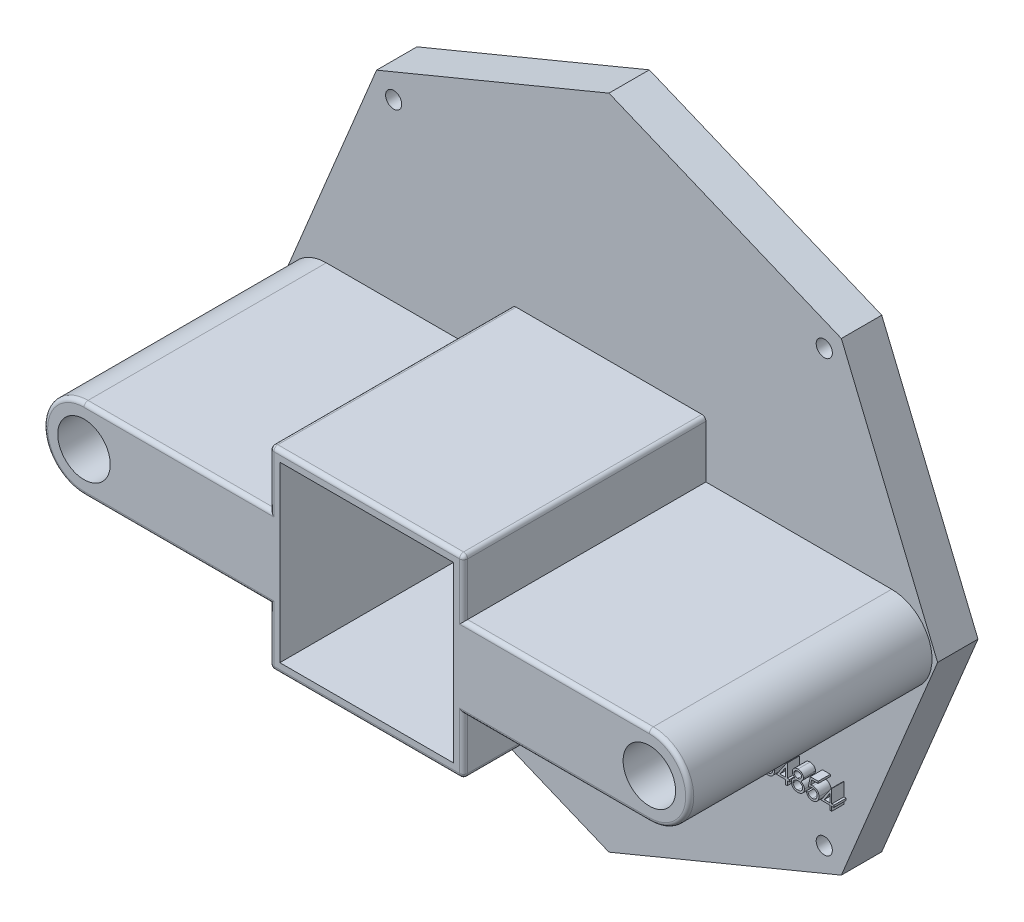
from build123d import *

# Parameters (mm, degrees)
SKETCH1_R                = 2
SKETCH1_R_2              = 10
BOSS_EXTRUDE1_DEPTH      = 10
SKETCH2_W                = 48
SKETCH2_H                = 48
SKETCH2_W_2              = 43
SKETCH2_H_2              = 43
BOSS_EXTRUDE2_DEPTH      = 70
BOSS_EXTRUDE3_DEPTH      = 60
BOSS_EXTRUDE3_DEPTH_BACK = 10
SKETCH3_R                = 10
SKETCH3_R_2              = 6.5
BOSS_EXTRUDE4_DEPTH      = 60
FILLET4_R                = 1
FILLET5_R                = 1
BOSS_EXTRUDE5_DEPTH      = 3
BOSS_EXTRUDE5_DEPTH_BACK = 3
SKETCH5_W                = 0.427403847
SKETCH5_H                = 4.7625
SKETCH5_W_2              = 0.427403846


with BuildPart() as part:
    # Sketch1 → Boss-Extrude1 (new body)
    with BuildSketch(Plane.XY):
        Polygon((-57.551821522, 57.551821522), (-81.390566536, 0), (-57.551821522, -57.551821522), (0, -81.390566536), (57.551821522, -57.551821522), (81.390566536, 0), (57.551821522, 57.551821522), (0, 81.390566536), align=None)
        with Locations((-53.319906984, -53.319906984)):
            Circle(SKETCH1_R, mode=Mode.SUBTRACT)
        with Locations((53.319906984, -53.319906984)):
            Circle(SKETCH1_R, mode=Mode.SUBTRACT)
        Polygon((-24, -24), (-24, 0), (-24, 24), (24, 24), (24, 0), (24, -24), align=None, mode=Mode.SUBTRACT)
        with Locations((-70, 0)):
            Circle(SKETCH1_R_2, mode=Mode.SUBTRACT)
        with Locations((-53.319906984, 53.319906984)):
            Circle(SKETCH1_R, mode=Mode.SUBTRACT)
        with BuildLine():
            ThreePointArc((80, 0), (70, -10), (60, 0))
            ThreePointArc((60, 0), (70, 10), (80, 0))
        make_face(mode=Mode.SUBTRACT)
        with Locations((53.319906984, 53.319906984)):
            Circle(SKETCH1_R, mode=Mode.SUBTRACT)
    extrude(amount=BOSS_EXTRUDE1_DEPTH)

    # Sketch2 → Boss-Extrude2 (add)
    with BuildSketch(Plane.XY):
        Rectangle(SKETCH2_W, SKETCH2_H)
        Rectangle(SKETCH2_W_2, SKETCH2_H_2, mode=Mode.SUBTRACT)
    extrude(amount=BOSS_EXTRUDE2_DEPTH)

    # Sketch3 → Boss-Extrude3 (add, two sides: drawn at the far end of the back side and taken through both)
    # profile 1 of 2: a face of its own
    with BuildSketch(Plane.XY.offset(10).offset(-BOSS_EXTRUDE3_DEPTH_BACK)):
        with Locations((70, 0)):
            Circle(SKETCH3_R)
        with Locations((70, 0)):
            Circle(SKETCH3_R_2, mode=Mode.SUBTRACT)
    # profile 2 of 2: a face of its own
    with BuildSketch(Plane.XY.offset(10).offset(-BOSS_EXTRUDE3_DEPTH_BACK)):
        with Locations((-70, 0)):
            Circle(SKETCH3_R)
        with Locations((-70, 0)):
            Circle(SKETCH3_R_2, mode=Mode.SUBTRACT)
    extrude(amount=BOSS_EXTRUDE3_DEPTH + BOSS_EXTRUDE3_DEPTH_BACK)

    # Sketch4 → Boss-Extrude4 (add)
    with BuildSketch(Plane.XY.offset(10)):
        with BuildLine():
            Line((24, -10), (70, -10))
            ThreePointArc((70, -10), (60, 0), (70, 10))
            Line((70, 10), (24, 10))
            Line((24, 10), (24, -10))
        make_face()
        with BuildLine():
            ThreePointArc((-70, 10), (-60, 0), (-70, -10))
            Line((-70, -10), (-24, -10))
            Line((-24, -10), (-24, 10))
            Line((-24, 10), (-70, 10))
        make_face()
    extrude(amount=BOSS_EXTRUDE4_DEPTH)

    # Fillet4
    fillet4_edges = [part.edges().sort_by_distance(p)[0] for p in [
        (-24, -24, 40),
        (24, -24, 40),
        (24, -17, 70),
        (0, -24, 70),
        (-24, -17, 70),
        (-24, 17, 70),
        (-24, 24, 40),
        (24, 24, 40),
        (0, 24, 70),
        (24, 17, 70),
    ]]
    fillet(fillet4_edges, radius=FILLET4_R)

    # Fillet5
    fillet5_edges = [part.edges().sort_by_distance(p)[0] for p in [
        (80, 0, 70),
        (-80, 0, 70),
        (-46.5, 10, 70),
        (46.5, 10, 70),
        (46.5, -10, 70),
        (-46.5, -10, 70),
    ]]
    fillet(fillet5_edges, radius=FILLET5_R)

    # Sketch5 → Boss-Extrude5 (add, two sides: drawn at the far end of the back side and taken through both)
    # profile 1 of 50: a face of its own
    with BuildSketch(Plane.XY.offset(10).offset(-BOSS_EXTRUDE5_DEPTH_BACK)):
        with BuildLine():
            Line((-42.819261608, -28.345701394), (-41.890039853, -28.345701394))
            add(Edge.make_bspline(
                [(-41.890039853, -28.345701394), (-41.844553245, -28.34594054), (-41.756388879, -28.346404064), (-41.628183138, -28.353592896), (-41.508101721, -28.363395033), (-41.396109802, -28.378948123), (-41.292259132, -28.397714792), (-41.19623674, -28.420441191), (-41.10834797, -28.447691691), (-41.003419568, -28.49102538), (-40.883784668, -28.555418692), (-40.754246856, -28.650571489), (-40.643478944, -28.766956734), (-40.54797542, -28.898242061), (-40.472046039, -29.042662522), (-40.417114959, -29.196775918), (-40.382337993, -29.358594431), (-40.378761445, -29.46968747), (-40.376953916, -29.525832103)],
                knots=[0, 0, 0, 0, 1.001505555, 1.941167018, 2.826882275, 3.653841531, 4.429895133, 5.150066043, 5.825578002, 6.45369114, 7.647487171, 8.808567382, 9.977351308, 11.170798116, 12.373658725, 13.556498008, 14.765093433, 16, 16, 16, 16], degree=3))
            add(Edge.make_bspline(
                [(-40.376953916, -29.525832103), (-40.378441473, -29.578427188), (-40.381364665, -29.681781489), (-40.409317491, -29.83294883), (-40.453078972, -29.976846025), (-40.513910043, -30.112947913), (-40.59297026, -30.238179366), (-40.686666758, -30.35355061), (-40.79971055, -30.454176869), (-40.884405815, -30.510432748), (-40.927427173, -30.539008185)],
                knots=[0, 0, 0, 0, 1.044552857, 2.05264487, 3.044412934, 4.028983338, 5.005914585, 5.980388656, 6.974128949, 8, 8, 8, 8], degree=3))
            add(Edge.make_bspline(
                [(-40.927427173, -30.539008185), (-40.873324591, -30.559779487), (-40.76981295, -30.599520133), (-40.627365197, -30.669781247), (-40.504635783, -30.746201833), (-40.400681095, -30.829656957), (-40.311775215, -30.91961216), (-40.234142462, -31.017386441), (-40.167901021, -31.124255251), (-40.11114165, -31.239104347), (-40.066852092, -31.360761006), (-40.033683451, -31.488084098), (-40.014677743, -31.620617064), (-40.011973132, -31.710812526), (-40.010607762, -31.756345925)],
                knots=[0, 0, 0, 0, 1.27268992, 2.434971085, 3.483601985, 4.442670788, 5.356604649, 6.2567628, 7.179492994, 8.113709626, 9.066344395, 10.018646069, 10.999752585, 12, 12, 12, 12], degree=3))
            add(Edge.make_bspline(
                [(-40.010607762, -31.756345925), (-40.01193697, -31.802837276), (-40.014552225, -31.894310312), (-40.033847115, -32.028687834), (-40.06651665, -32.157105172), (-40.111517031, -32.280392938), (-40.170248609, -32.398312621), (-40.241724161, -32.510997813), (-40.326947824, -32.617316313), (-40.422283371, -32.718449528), (-40.530136504, -32.809383053), (-40.646499014, -32.890366926), (-40.772836328, -32.956968532), (-40.907073505, -33.012915689), (-41.050716378, -33.055651913), (-41.203119926, -33.085550308), (-41.364152708, -33.105695734), (-41.474655977, -33.107352002), (-41.531325911, -33.108201394)],
                knots=[0, 0, 0, 0, 0.978564426, 1.925352924, 2.850884081, 3.763762016, 4.682927383, 5.618979971, 6.567305752, 7.547517671, 8.540179244, 9.531824382, 10.526200242, 11.540722885, 12.589160233, 13.674978461, 14.80764778, 16, 16, 16, 16], degree=3))
            Line((-41.531325911, -33.108201394), (-42.819261608, -33.108201394))
            Line((-42.819261608, -33.108201394), (-42.819261608, -28.345701394))
        make_face()
        with BuildLine():
            Line((-42.391857762, -28.834162932), (-42.391857762, -30.36060524))
            Line((-42.391857762, -30.36060524), (-42.104695803, -30.36060524))
            add(Edge.make_bspline(
                [(-42.104695803, -30.36060524), (-42.062719406, -30.360061059), (-41.981612454, -30.35900959), (-41.864155737, -30.355997626), (-41.75512848, -30.34756386), (-41.654718879, -30.339132518), (-41.563085053, -30.325423882), (-41.480430013, -30.309106029), (-41.405456565, -30.291848219), (-41.318997398, -30.26249831), (-41.220926707, -30.219121902), (-41.116378805, -30.151804868), (-41.024211544, -30.071625659), (-40.946382514, -29.979109386), (-40.882685477, -29.877237897), (-40.838443601, -29.767636606), (-40.808443546, -29.65303707), (-40.805733641, -29.574362947), (-40.804357762, -29.534418341)],
                knots=[0, 0, 0, 0, 1.156816544, 2.235205308, 3.236616184, 4.169592532, 5.011045266, 5.787822928, 6.49130361, 7.128639758, 8.301311294, 9.436451833, 10.541879658, 11.654887649, 12.756523258, 13.837046038, 14.901820046, 16, 16, 16, 16], degree=3))
            add(Edge.make_bspline(
                [(-40.804357762, -29.534418341), (-40.805073743, -29.507985416), (-40.806478217, -29.456134348), (-40.817980747, -29.380547548), (-40.837530911, -29.309458727), (-40.862641931, -29.24189367), (-40.897732968, -29.179965045), (-40.939048967, -29.121531626), (-40.988967709, -29.06858335), (-41.045787481, -29.019094854), (-41.1111135, -28.975219264), (-41.184906794, -28.936791655), (-41.26816574, -28.905847955), (-41.359487161, -28.878747762), (-41.460276747, -28.85971369), (-41.569371408, -28.843856759), (-41.687664722, -28.835783993), (-41.769505022, -28.834715338), (-41.811809685, -28.834162932)],
                knots=[0, 0, 0, 0, 0.91205012, 1.789085906, 2.630437955, 3.453916878, 4.269457761, 5.079663411, 5.91843418, 6.774407191, 7.675494373, 8.627863946, 9.638891023, 10.736472738, 11.911756761, 13.175263542, 14.539845004, 16, 16, 16, 16], degree=3))
            Line((-41.811809685, -28.834162932), (-42.391857762, -28.834162932))
        make_face(mode=Mode.SUBTRACT)
        with BuildLine():
            Line((-42.391857762, -30.849066778), (-42.391857762, -32.619739855))
            Line((-42.391857762, -32.619739855), (-41.783188891, -32.619739855))
            add(Edge.make_bspline(
                [(-41.783188891, -32.619739855), (-41.739620282, -32.619217685), (-41.65564753, -32.61821127), (-41.534406213, -32.614925751), (-41.422034204, -32.607452333), (-41.319044276, -32.595687802), (-41.224324339, -32.582926412), (-41.139010679, -32.565766062), (-41.062411726, -32.546105155), (-40.973592043, -32.515714728), (-40.87357477, -32.468502744), (-40.765791426, -32.397318029), (-40.669961465, -32.312513814), (-40.588583594, -32.214364248), (-40.52189092, -32.107641621), (-40.473374033, -31.994504556), (-40.44345076, -31.876822463), (-40.439828309, -31.796585615), (-40.438011608, -31.756345925)],
                knots=[0, 0, 0, 0, 1.160039823, 2.235823828, 3.228722157, 4.157150951, 4.99529583, 5.772374946, 6.472645482, 7.099169577, 8.269452708, 9.405989375, 10.527446681, 11.663510218, 12.788923519, 13.866172445, 14.929861265, 16, 16, 16, 16], degree=3))
            add(Edge.make_bspline(
                [(-40.438011608, -31.756345925), (-40.438387307, -31.731181772), (-40.439132645, -31.681259367), (-40.450372982, -31.607895342), (-40.466720426, -31.53683085), (-40.48785427, -31.467872924), (-40.518632902, -31.402268294), (-40.554564665, -31.338719454), (-40.596694287, -31.277142399), (-40.662340812, -31.199292868), (-40.757824834, -31.109598647), (-40.893497268, -31.021781546), (-41.047764573, -30.950959351), (-41.159652698, -30.920888278), (-41.217451211, -30.905354338)],
                knots=[0, 0, 0, 0, 0.723448775, 1.435228256, 2.130040452, 2.821711965, 3.505591119, 4.210454504, 4.921174351, 5.648778258, 7.137944449, 8.670945889, 10.280296675, 12, 12, 12, 12], degree=3))
            add(Edge.make_bspline(
                [(-41.217451211, -30.905354338), (-41.240622945, -30.900652956), (-41.290864044, -30.89045939), (-41.372789359, -30.879699265), (-41.466319238, -30.870112952), (-41.571669653, -30.863022055), (-41.688973894, -30.855692508), (-41.818482487, -30.852842055), (-41.959666547, -30.849441276), (-42.057627596, -30.849194804), (-42.108511908, -30.849066778)],
                knots=[0, 0, 0, 0, 0.634451884, 1.375622551, 2.216452059, 3.157844607, 4.20941857, 5.370758133, 6.634282058, 8, 8, 8, 8], degree=3))
            Line((-42.108511908, -30.849066778), (-42.391857762, -30.849066778))
        make_face(mode=Mode.SUBTRACT)
    # profile 2 of 50: a face of its own
    with BuildSketch(Plane.XY.offset(10).offset(-BOSS_EXTRUDE5_DEPTH_BACK)):
        Polygon((-39.033684685, -28.345701394), (-36.347146223, -28.345701394), (-36.347146223, -28.834162932), (-38.606280839, -28.834162932), (-38.606280839, -30.299547548), (-36.347146223, -30.299547548), (-36.347146223, -30.788009086), (-38.606280839, -30.788009086), (-38.606280839, -32.619739855), (-36.347146223, -32.619739855), (-36.347146223, -33.108201394), (-39.033684685, -33.108201394), align=None)
    # profile 3 of 50: a face of its own
    with BuildSketch(Plane.XY.offset(10).offset(-BOSS_EXTRUDE5_DEPTH_BACK)):
        Polygon((-35.492338531, -33.108201394), (-35.492338531, -28.345701394), (-35.402660045, -28.345701394), (-32.256280839, -32.094071286), (-32.256280839, -28.345701394), (-31.828876992, -28.345701394), (-31.828876992, -33.108201394), (-31.92618769, -33.108201394), (-35.064934685, -29.36841774), (-35.064934685, -33.108201394), align=None)
    # profile 4 of 50: a face of its own
    with BuildSketch(Plane.XY.offset(10).offset(-BOSS_EXTRUDE5_DEPTH_BACK)):
        with BuildLine():
            Line((-29.081280839, -28.345701394), (-28.653876992, -28.345701394))
            Line((-28.653876992, -28.345701394), (-28.653876992, -31.561724531))
            add(Edge.make_bspline(
                [(-28.653876992, -31.561724531), (-28.654304146, -31.621194781), (-28.655124333, -31.735384919), (-28.659634299, -31.899859756), (-28.66798021, -32.050042725), (-28.680138209, -32.186275326), (-28.69635824, -32.308130767), (-28.714919782, -32.416550601), (-28.737388983, -32.510629954), (-28.771225139, -32.616269492), (-28.826706833, -32.732125883), (-28.910209839, -32.857250571), (-29.013940894, -32.966697461), (-29.134093371, -33.061747062), (-29.271717407, -33.137480652), (-29.423978913, -33.191848234), (-29.589940591, -33.225010007), (-29.705055948, -33.228512356), (-29.764363771, -33.230316778)],
                knots=[0, 0, 0, 0, 1.237770943, 2.376671248, 3.424123796, 4.367912054, 5.222547132, 5.982086412, 6.656319012, 7.234008312, 8.288027371, 9.317870876, 10.352700517, 11.413286737, 12.494591526, 13.606319346, 14.766767577, 16, 16, 16, 16], degree=3))
            add(Edge.make_bspline(
                [(-29.764363771, -33.230316778), (-29.810571394, -33.228846378), (-29.903544193, -33.225887835), (-30.041916193, -33.201773647), (-30.17989531, -33.164604317), (-30.318213889, -33.110172214), (-30.459604678, -33.036141739), (-30.605982628, -32.939279542), (-30.759230613, -32.819765929), (-30.86017287, -32.728546711), (-30.913011608, -32.680797548)],
                knots=[0, 0, 0, 0, 0.848567217, 1.707373443, 2.573483905, 3.470863513, 4.432650262, 5.500696352, 6.691726801, 8, 8, 8, 8], degree=3))
            Line((-30.913011608, -32.680797548), (-30.661148627, -32.314451394))
            add(Edge.make_bspline(
                [(-30.661148627, -32.314451394), (-30.603042482, -32.354520886), (-30.493330503, -32.430177313), (-30.332079817, -32.52750458), (-30.189208691, -32.610950609), (-30.095750823, -32.653476032), (-30.052479757, -32.673165336)],
                knots=[0, 0, 0, 0, 1.196737151, 2.259595785, 3.194191475, 4, 4, 4, 4], degree=3))
            add(Edge.make_bspline(
                [(-30.052479757, -32.673165336), (-30.026239319, -32.683451598), (-29.974775976, -32.703625247), (-29.896092564, -32.726139487), (-29.817858246, -32.738443624), (-29.765990955, -32.740731438), (-29.74051311, -32.74185524)],
                knots=[0, 0, 0, 0, 1.051806502, 2.062826769, 3.048436908, 4, 4, 4, 4], degree=3))
            add(Edge.make_bspline(
                [(-29.74051311, -32.74185524), (-29.707607245, -32.74046359), (-29.642564481, -32.737712811), (-29.548043832, -32.713425047), (-29.457613439, -32.676353199), (-29.374515084, -32.622072545), (-29.297926753, -32.557531934), (-29.234731337, -32.479486793), (-29.18204823, -32.392991651), (-29.150344004, -32.311115494), (-29.130144511, -32.236444079), (-29.117324368, -32.167818991), (-29.106113905, -32.087589265), (-29.096341865, -31.995659135), (-29.090620782, -31.891844551), (-29.084201922, -31.776450342), (-29.081881549, -31.649185576), (-29.081487185, -31.560452102), (-29.081280839, -31.514023209)],
                knots=[0, 0, 0, 0, 0.997221856, 1.971139923, 2.944579524, 3.951425367, 4.971190333, 5.972282193, 6.985401279, 8.033996657, 8.624075553, 9.332086008, 10.151144245, 11.082816738, 12.137127781, 13.306538797, 14.590673636, 16, 16, 16, 16], degree=3))
            Line((-29.081280839, -31.514023209), (-29.081280839, -28.345701394))
        make_face()
    # profile 5 of 50: a face of its own
    with BuildSketch(Plane.XY.offset(10).offset(-BOSS_EXTRUDE5_DEPTH_BACK)):
        Polygon((-25.478876992, -28.345701394), (-23.280800069, -33.108201394), (-23.745410947, -33.108201394), (-24.449482461, -31.581759086), (-26.6084443, -31.581759086), (-27.33255037, -33.108201394), (-27.7990693, -33.108201394), (-25.539934685, -28.345701394), align=None)
        Polygon((-25.514175971, -29.273969122), (-26.376615875, -31.093297548), (-24.674632702, -31.093297548), align=None, mode=Mode.SUBTRACT)
    # profile 6 of 50: a face of its own
    with BuildSketch(Plane.XY.offset(10).offset(-BOSS_EXTRUDE5_DEPTH_BACK)):
        Polygon((-22.670223146, -33.108201394), (-22.041519721, -28.345701394), (-21.980462028, -28.345701394), (-20.014213531, -32.253393701), (-18.052735166, -28.345701394), (-17.990723447, -28.345701394), (-17.358203916, -33.108201394), (-17.787515815, -33.108201394), (-18.243540454, -29.681338413), (-19.962696103, -33.108201394), (-20.059052774, -33.108201394), (-21.784886608, -29.673706201), (-22.239957221, -33.108201394), align=None)
    # profile 7 of 50: a face of its own
    with BuildSketch(Plane.XY.offset(10).offset(-BOSS_EXTRUDE5_DEPTH_BACK)):
        with Locations((-16.167578916, -30.726951394)):
            Rectangle(SKETCH5_W, SKETCH5_H)
    # profile 8 of 50: a face of its own
    with BuildSketch(Plane.XY.offset(10).offset(-BOSS_EXTRUDE5_DEPTH_BACK)):
        Polygon((-14.732723146, -33.108201394), (-14.732723146, -28.345701394), (-14.643044661, -28.345701394), (-11.496665454, -32.094071286), (-11.496665454, -28.345701394), (-11.069261608, -28.345701394), (-11.069261608, -33.108201394), (-11.166572305, -33.108201394), (-14.3053193, -29.36841774), (-14.3053193, -33.108201394), align=None)
    # profile 9 of 50: a face of its own
    with BuildSketch(Plane.XY.offset(10).offset(-BOSS_EXTRUDE5_DEPTH_BACK)):
        with BuildLine():
            Line((-3.559165454, -29.158531923), (-3.925511608, -29.505797548))
            add(Edge.make_bspline(
                [(-3.925511608, -29.505797548), (-3.991804095, -29.443434838), (-4.122808287, -29.320196492), (-4.336386331, -29.160297602), (-4.559221847, -29.023319802), (-4.790152066, -28.911868816), (-5.02345817, -28.822942381), (-5.256043398, -28.759630876), (-5.485522013, -28.71925503), (-5.638149549, -28.714426713), (-5.713357161, -28.712047548)],
                knots=[0, 0, 0, 0, 1.08915593, 2.152340314, 3.188132944, 4.216796309, 5.218260357, 6.173443236, 7.099959455, 8, 8, 8, 8], degree=3))
            add(Edge.make_bspline(
                [(-5.713357161, -28.712047548), (-5.759505377, -28.712610347), (-5.851682123, -28.713734486), (-5.98859984, -28.728082151), (-6.124081585, -28.748717198), (-6.257871606, -28.778573824), (-6.390230035, -28.816414009), (-6.520696535, -28.863747086), (-6.649514478, -28.918931186), (-6.775470467, -28.982697623), (-6.897581652, -29.052746986), (-7.012911489, -29.13037375), (-7.122195079, -29.213089925), (-7.223378372, -29.302966436), (-7.317043393, -29.399189163), (-7.405419571, -29.499968162), (-7.485398677, -29.608056799), (-7.557640584, -29.721466383), (-7.622086214, -29.83820504), (-7.678975847, -29.957149144), (-7.726732956, -30.077904175), (-7.76451925, -30.200621659), (-7.795694104, -30.324352212), (-7.817625563, -30.449952563), (-7.829989995, -30.577557199), (-7.832128739, -30.663006326), (-7.833203916, -30.705962812)],
                knots=[0, 0, 0, 0, 1.02818874, 2.053710826, 3.065248034, 4.081641283, 5.106893873, 6.131558223, 7.173050175, 8.228653731, 9.27666206, 10.308777013, 11.325269123, 12.329503258, 13.32196095, 14.316845687, 15.314881793, 16.315733098, 17.311955233, 18.285320748, 19.252783886, 20.203351036, 21.145449891, 22.095197417, 23.042428769, 24, 24, 24, 24], degree=3))
            add(Edge.make_bspline(
                [(-7.833203916, -30.705962812), (-7.832175599, -30.749874174), (-7.830121774, -30.837576991), (-7.816976839, -30.968469639), (-7.792581626, -31.097418276), (-7.759968422, -31.224846629), (-7.719173098, -31.350972934), (-7.668319577, -31.475250385), (-7.608086742, -31.597674382), (-7.538368434, -31.717141853), (-7.461915064, -31.833514253), (-7.376267515, -31.943132745), (-7.285289364, -32.047457045), (-7.185666164, -32.144170853), (-7.08059243, -32.235861083), (-6.966928869, -32.320001561), (-6.846910521, -32.398213), (-6.720354279, -32.469509693), (-6.58863335, -32.533202736), (-6.453573268, -32.589840966), (-6.314742562, -32.63648535), (-6.17287083, -32.674501127), (-6.0281272, -32.705661889), (-5.879776954, -32.725708585), (-5.728910876, -32.740255752), (-5.627212952, -32.741319381), (-5.575977353, -32.74185524)],
                knots=[0, 0, 0, 0, 0.93586088, 1.869166235, 2.799637598, 3.729985548, 4.670839027, 5.622275134, 6.589130586, 7.576015415, 8.568469353, 9.55398029, 10.53834874, 11.515998671, 12.510579167, 13.508179873, 14.527009472, 15.561807829, 16.601455013, 17.643573243, 18.680854198, 19.719860599, 20.772568776, 21.833555941, 22.908541556, 24, 24, 24, 24], degree=3))
            add(Edge.make_bspline(
                [(-5.575977353, -32.74185524), (-5.514230388, -32.740564499), (-5.392980189, -32.738029918), (-5.214745066, -32.718299167), (-5.04356303, -32.687483352), (-4.879915089, -32.642354042), (-4.723611172, -32.584790827), (-4.574078277, -32.515400676), (-4.432493698, -32.431522085), (-4.298431808, -32.33685193), (-4.17493721, -32.231376391), (-4.063557134, -32.117560186), (-3.966068093, -31.995955781), (-3.881017056, -31.867279405), (-3.810656351, -31.730465972), (-3.752903833, -31.58618595), (-3.708635319, -31.434374442), (-3.690463014, -31.329474758), (-3.681280839, -31.276470624)],
                knots=[0, 0, 0, 0, 1.13008108, 2.219097802, 3.278683437, 4.311054135, 5.322181354, 6.324827112, 7.324222904, 8.330512327, 9.32562643, 10.293043162, 11.24128371, 12.174520618, 13.111833804, 14.052305215, 15.015860969, 16, 16, 16, 16], degree=3))
            Line((-3.681280839, -31.276470624), (-5.268780839, -31.276470624))
            Line((-5.268780839, -31.276470624), (-5.268780839, -30.788009086))
            Line((-5.268780839, -30.788009086), (-3.253876992, -30.788009086))
            add(Edge.make_bspline(
                [(-3.253876992, -30.788009086), (-3.256198165, -30.879051062), (-3.260741118, -31.057236654), (-3.292607571, -31.31709263), (-3.34406504, -31.56252697), (-3.414359964, -31.79379815), (-3.505358113, -32.010578431), (-3.616082875, -32.213087913), (-3.748306369, -32.400018325), (-3.897318791, -32.57289572), (-4.064550519, -32.727104398), (-4.24548282, -32.86263962), (-4.440414623, -32.976807108), (-4.64916154, -33.069690366), (-4.871040201, -33.142181052), (-5.106564032, -33.193577376), (-5.355413639, -33.224370291), (-5.525961045, -33.228304632), (-5.613184384, -33.230316778)],
                knots=[0, 0, 0, 0, 1.140356446, 2.231883559, 3.274166699, 4.278491846, 5.25512956, 6.21435461, 7.1637429, 8.11826594, 9.068280886, 10.0076534, 10.945064095, 11.891975133, 12.864533718, 13.863980011, 14.907571808, 16, 16, 16, 16], degree=3))
            add(Edge.make_bspline(
                [(-5.613184384, -33.230316778), (-5.66694639, -33.229542367), (-5.772982392, -33.228014978), (-5.929588262, -33.217160087), (-6.081876167, -33.200449732), (-6.229823922, -33.175215117), (-6.373975738, -33.144306963), (-6.513611673, -33.104728249), (-6.649263651, -33.058914769), (-6.781141338, -33.006805299), (-6.908047739, -32.946428152), (-7.030548107, -32.879331821), (-7.149319585, -32.805862284), (-7.263553135, -32.724748954), (-7.373843956, -32.636598535), (-7.479480891, -32.541234346), (-7.581055325, -32.438947929), (-7.644682956, -32.366314348), (-7.676743579, -32.329715817)],
                knots=[0, 0, 0, 0, 1.107784379, 2.184907829, 3.233506516, 4.263428166, 5.276301166, 6.270063455, 7.25232949, 8.225834625, 9.190232166, 10.146266622, 11.1027726, 12.066435141, 13.031522626, 14.010570082, 14.99756817, 16, 16, 16, 16], degree=3))
            add(Edge.make_bspline(
                [(-7.676743579, -32.329715817), (-7.723260865, -32.27165325), (-7.815523298, -32.156491894), (-7.934283932, -31.971979113), (-8.035522984, -31.780932296), (-8.117666342, -31.582819605), (-8.18180781, -31.377826348), (-8.227808461, -31.166214469), (-8.254760522, -30.947711472), (-8.258643371, -30.799849094), (-8.260607762, -30.725043341)],
                knots=[0, 0, 0, 0, 1.023165419, 2.029347347, 3.013907458, 3.994755782, 4.975994455, 5.96558838, 6.970761222, 8, 8, 8, 8], degree=3))
            add(Edge.make_bspline(
                [(-8.260607762, -30.725043341), (-8.259883538, -30.669027833), (-8.258444294, -30.557708739), (-8.240992431, -30.392440046), (-8.215953359, -30.23010589), (-8.179150045, -30.070838969), (-8.132754771, -29.914532913), (-8.074851634, -29.761115148), (-8.007435186, -29.610495137), (-7.929077779, -29.463709624), (-7.84187714, -29.322706405), (-7.747239161, -29.188053109), (-7.643819977, -29.062201917), (-7.533308478, -28.943558995), (-7.414386145, -28.83361485), (-7.288167072, -28.731351578), (-7.154553988, -28.636632004), (-7.013126543, -28.55094805), (-6.865995658, -28.473981123), (-6.713514013, -28.406504375), (-6.555728155, -28.350737792), (-6.393820194, -28.303420613), (-6.226564595, -28.268429654), (-6.055175097, -28.24305404), (-5.878758337, -28.225690509), (-5.75951074, -28.224294068), (-5.699046764, -28.223586009)],
                knots=[0, 0, 0, 0, 1.008945113, 2.00506715, 2.99143336, 3.967273523, 4.948097931, 5.927297278, 6.919902385, 7.919676788, 8.923139349, 9.905703106, 10.883022732, 11.856032218, 12.825136022, 13.798837087, 14.781400844, 15.773989409, 16.776158564, 17.77167057, 18.775803737, 19.789618931, 20.80898985, 21.851988756, 22.910860228, 24, 24, 24, 24], degree=3))
            add(Edge.make_bspline(
                [(-5.699046764, -28.223586009), (-5.649736868, -28.224374532), (-5.551961139, -28.22593808), (-5.406465768, -28.23677569), (-5.263219273, -28.253953185), (-5.122009257, -28.27739392), (-4.983316594, -28.309321299), (-4.846746184, -28.347527822), (-4.712100055, -28.392012052), (-4.579800187, -28.445064732), (-4.448957009, -28.505281272), (-4.318843005, -28.573063107), (-4.189902745, -28.649569274), (-4.061912624, -28.735026942), (-3.934065546, -28.827968379), (-3.808383657, -28.931051771), (-3.681833223, -29.040212021), (-3.60046004, -29.118700992), (-3.559165454, -29.158531923)],
                knots=[0, 0, 0, 0, 0.985871117, 1.954866573, 2.915460327, 3.869826059, 4.81536089, 5.759505086, 6.70452669, 7.649098992, 8.607881297, 9.583363685, 10.581137262, 11.603961102, 12.659522466, 13.73993555, 14.853081303, 16, 16, 16, 16], degree=3))
        make_face()
    # profile 10 of 50: a face of its own
    with BuildSketch(Plane.XY.offset(10).offset(-BOSS_EXTRUDE5_DEPTH_BACK)):
        with BuildLine():
            Line((-2.276953916, -28.345701394), (-1.3238815, -28.345701394))
            add(Edge.make_bspline(
                [(-1.3238815, -28.345701394), (-1.260280178, -28.345913102), (-1.138158596, -28.346319605), (-0.96320711, -28.348586232), (-0.804238811, -28.355082766), (-0.661336815, -28.360673374), (-0.534503745, -28.370867766), (-0.423350682, -28.380611361), (-0.328389565, -28.393366235), (-0.270905031, -28.405211828), (-0.244877593, -28.410575192)],
                knots=[0, 0, 0, 0, 1.410062039, 2.707475311, 3.878576406, 4.937260626, 5.877586885, 6.699081471, 7.410979367, 8, 8, 8, 8], degree=3))
            add(Edge.make_bspline(
                [(-0.244877593, -28.410575192), (-0.210034294, -28.419184112), (-0.141090998, -28.4362183), (-0.041826801, -28.472222257), (0.052762333, -28.513886818), (0.142283487, -28.562823166), (0.22628826, -28.619394562), (0.305642818, -28.6826244), (0.380707252, -28.752166705), (0.448445828, -28.829774829), (0.512316466, -28.911195223), (0.566185276, -28.999238549), (0.612621664, -29.091306556), (0.649592975, -29.188335578), (0.679362646, -29.289384632), (0.70035335, -29.39536903), (0.712941573, -29.505805928), (0.71422317, -29.581132226), (0.714873008, -29.619326694)],
                knots=[0, 0, 0, 0, 1.027469482, 2.033020251, 3.019912614, 3.986113645, 4.951240523, 5.91722682, 6.890402269, 7.87763091, 8.8651537, 9.85103654, 10.82876324, 11.815024772, 12.821070561, 13.842952187, 14.906261191, 16, 16, 16, 16], degree=3))
            add(Edge.make_bspline(
                [(0.714873008, -29.619326694), (0.712874121, -29.682783747), (0.708973775, -29.806604894), (0.672608545, -29.986302021), (0.613041209, -30.153927482), (0.530958448, -30.309270214), (0.42642909, -30.449302199), (0.300801428, -30.572297783), (0.154005378, -30.675222093), (0.017349773, -30.746595374), (-0.103364906, -30.792305724), (-0.202742378, -30.824468055), (-0.311146372, -30.849317372), (-0.427538246, -30.871578837), (-0.552402363, -30.888385964), (-0.685439452, -30.900695795), (-0.826744394, -30.90838934), (-0.923816485, -30.909535068), (-0.973753795, -30.910124471)],
                knots=[0, 0, 0, 0, 1.260483769, 2.459530307, 3.627416485, 4.787058657, 5.939039949, 7.08810263, 8.267026773, 9.491475466, 10.141966685, 10.831826277, 11.566392101, 12.351337768, 13.187381173, 14.07005841, 15.007169909, 16, 16, 16, 16], degree=3))
            Line((-0.973753795, -30.910124471), (0.7759307, -33.108201394))
            Line((0.7759307, -33.108201394), (0.247400051, -33.108201394))
            Line((0.247400051, -33.108201394), (-1.502284444, -30.910124471))
            Line((-1.502284444, -30.910124471), (-1.849550069, -30.910124471))
            Line((-1.849550069, -30.910124471), (-1.849550069, -33.108201394))
            Line((-1.849550069, -33.108201394), (-2.276953916, -33.108201394))
            Line((-2.276953916, -33.108201394), (-2.276953916, -28.345701394))
        make_face()
        with BuildLine():
            Line((-1.849550069, -28.834162932), (-1.849550069, -30.421662932))
            Line((-1.849550069, -30.421662932), (-0.977569901, -30.428341117))
            add(Edge.make_bspline(
                [(-0.977569901, -30.428341117), (-0.936857277, -30.428359129), (-0.857944615, -30.42839404), (-0.743779782, -30.422959651), (-0.63748063, -30.416777493), (-0.539453749, -30.407321419), (-0.449655349, -30.395134765), (-0.368130311, -30.379890704), (-0.294745559, -30.362130576), (-0.209158619, -30.334641935), (-0.113586767, -30.291090889), (-0.009721459, -30.22772855), (0.07872815, -30.148032712), (0.15345567, -30.056900974), (0.213503218, -29.956703078), (0.255837835, -29.84864009), (0.282701658, -29.735440094), (0.285870143, -29.657637026), (0.287469161, -29.618372668)],
                knots=[0, 0, 0, 0, 1.146690395, 2.22261258, 3.21895312, 4.145990853, 4.996080663, 5.770904154, 6.481378293, 7.121626537, 8.300444488, 9.431385265, 10.535395872, 11.636531494, 12.74115979, 13.810798291, 14.895190096, 16, 16, 16, 16], degree=3))
            add(Edge.make_bspline(
                [(0.287469161, -29.618372668), (0.285833418, -29.580073223), (0.282591972, -29.504177698), (0.256127754, -29.393067334), (0.211374703, -29.288201234), (0.151064801, -29.190005989), (0.07758738, -29.100871398), (-0.008570073, -29.024607236), (-0.105051785, -28.961674929), (-0.195227951, -28.921459861), (-0.27582879, -28.896803918), (-0.345809863, -28.879453227), (-0.424882981, -28.865513432), (-0.513432087, -28.854344606), (-0.611079164, -28.844744843), (-0.718317942, -28.83827903), (-0.834436918, -28.834450165), (-0.914918993, -28.834260905), (-0.956581319, -28.834162932)],
                knots=[0, 0, 0, 0, 1.101028733, 2.181837193, 3.264309656, 4.369019818, 5.486613113, 6.575447106, 7.666700264, 8.788928104, 9.402425223, 10.0903467, 10.862060571, 11.710948788, 12.657782767, 13.684531032, 14.801375019, 16, 16, 16, 16], degree=3))
            Line((-0.956581319, -28.834162932), (-1.849550069, -28.834162932))
        make_face(mode=Mode.SUBTRACT)
    # profile 11 of 50: a face of its own
    with BuildSketch(Plane.XY.offset(10).offset(-BOSS_EXTRUDE5_DEPTH_BACK)):
        Polygon((1.752853777, -28.345701394), (4.439392238, -28.345701394), (4.439392238, -28.834162932), (2.180257623, -28.834162932), (2.180257623, -30.299547548), (4.439392238, -30.299547548), (4.439392238, -30.788009086), (2.180257623, -30.788009086), (2.180257623, -32.619739855), (4.439392238, -32.619739855), (4.439392238, -33.108201394), (1.752853777, -33.108201394), align=None)
    # profile 12 of 50: a face of its own
    with BuildSketch(Plane.XY.offset(10).offset(-BOSS_EXTRUDE5_DEPTH_BACK)):
        Polygon((5.294199931, -28.345701394), (7.980738392, -28.345701394), (7.980738392, -28.834162932), (5.721603777, -28.834162932), (5.721603777, -30.299547548), (7.980738392, -30.299547548), (7.980738392, -30.788009086), (5.721603777, -30.788009086), (5.721603777, -32.619739855), (7.980738392, -32.619739855), (7.980738392, -33.108201394), (5.294199931, -33.108201394), align=None)
    # profile 13 of 50: a face of its own
    with BuildSketch(Plane.XY.offset(10).offset(-BOSS_EXTRUDE5_DEPTH_BACK)):
        Polygon((8.835546084, -33.108201394), (8.835546084, -28.345701394), (8.92522457, -28.345701394), (12.071603777, -32.094071286), (12.071603777, -28.345701394), (12.499007623, -28.345701394), (12.499007623, -33.108201394), (12.401696926, -33.108201394), (9.262949931, -29.36841774), (9.262949931, -33.108201394), align=None)
    # profile 14 of 50: a face of its own
    with BuildSketch(Plane.XY.offset(10).offset(-BOSS_EXTRUDE5_DEPTH_BACK)):
        Polygon((17.968441217, -28.345701394), (18.849007623, -28.345701394), (18.849007623, -33.108201394), (18.421603777, -33.108201394), (18.421603777, -28.834162932), (17.688911469, -28.834162932), align=None)
    # profile 15 of 50: a face of its own
    with BuildSketch(Plane.XY.offset(10).offset(-BOSS_EXTRUDE5_DEPTH_BACK)):
        with BuildLine():
            add(Edge.make_bspline(
                [(20.6196807, -30.728859447), (20.620127039, -30.65252693), (20.620994059, -30.504249915), (20.630639374, -30.288189385), (20.646662251, -30.085496991), (20.668620605, -29.896163034), (20.695342285, -29.720138633), (20.731014072, -29.557894195), (20.771580778, -29.408678802), (20.818596785, -29.272005872), (20.871648027, -29.146034069), (20.929388931, -29.028434063), (20.994111027, -28.91938379), (21.062115326, -28.817142726), (21.136154609, -28.723384484), (21.214121892, -28.636785004), (21.299060231, -28.559345733), (21.388082253, -28.488797728), (21.481993942, -28.426953983), (21.578118427, -28.372480864), (21.677117339, -28.325944616), (21.779260966, -28.289354415), (21.883631232, -28.259131799), (21.990592991, -28.238463981), (22.100322847, -28.225459759), (22.174388478, -28.224216518), (22.211950832, -28.223586009)],
                knots=[0, 0, 0, 0, 1.646270934, 3.197905019, 4.663502075, 6.030701355, 7.308322542, 8.50163776, 9.611534131, 10.641858119, 11.616356847, 12.558055219, 13.465016945, 14.349605745, 15.204443733, 16.039544428, 16.859896111, 17.680448484, 18.487036065, 19.28249412, 20.06191084, 20.843045899, 21.620316918, 22.403196591, 23.190181807, 24, 24, 24, 24], degree=3))
            add(Edge.make_bspline(
                [(22.211950832, -28.223586009), (22.249826965, -28.224249786), (22.325150677, -28.22556983), (22.436512045, -28.238257052), (22.545300719, -28.25930883), (22.651052901, -28.289137013), (22.754637257, -28.326142559), (22.855243583, -28.372525386), (22.953496791, -28.426516988), (23.047835504, -28.489958764), (23.139295391, -28.56069179), (23.225629941, -28.640650992), (23.306847011, -28.729029003), (23.383965909, -28.824880254), (23.454798704, -28.930043173), (23.522253981, -29.042688694), (23.582631644, -29.164786763), (23.640781327, -29.294300186), (23.690973977, -29.434812521), (23.736239832, -29.585531713), (23.772814429, -29.748238018), (23.803279831, -29.922077766), (23.826881279, -30.107689377), (23.844070696, -30.30467497), (23.853150858, -30.513164145), (23.854860869, -30.655709647), (23.855738392, -30.728859447)],
                knots=[0, 0, 0, 0, 0.810914788, 1.612654377, 2.396697861, 3.181598691, 3.963628158, 4.749916497, 5.551656086, 6.361998678, 7.18212741, 8.025565596, 8.878627764, 9.750805457, 10.657531673, 11.591944965, 12.560506719, 13.57287815, 14.630710178, 15.753379473, 16.941251878, 18.199788006, 19.531962791, 20.947069417, 22.433333509, 24, 24, 24, 24], degree=3))
            add(Edge.make_bspline(
                [(23.855738392, -30.728859447), (23.854851772, -30.801690193), (23.853124228, -30.943597932), (23.844172488, -31.151149009), (23.826539493, -31.347089203), (23.804482331, -31.53188844), (23.773932985, -31.704777557), (23.73637024, -31.866354824), (23.694663908, -32.017318007), (23.643181563, -32.156430376), (23.586833418, -32.285632542), (23.525526169, -32.406283197), (23.459844727, -32.51944876), (23.388286471, -32.624223415), (23.312013791, -32.721349374), (23.229394228, -32.80911221), (23.142756753, -32.889626589), (23.051027716, -32.961270411), (22.955217712, -33.023978663), (22.857301968, -33.080058938), (22.75554315, -33.125279141), (22.652247311, -33.164107178), (22.545936927, -33.193771365), (22.436744517, -33.214282575), (22.325225496, -33.228667841), (22.249839795, -33.229765229), (22.211950832, -33.230316778)],
                knots=[0, 0, 0, 0, 1.561518951, 3.042555995, 4.452378317, 5.7783523, 7.031515105, 8.214008947, 9.334062868, 10.386615937, 11.391082383, 12.354592575, 13.286541444, 14.194233754, 15.072674879, 15.931287219, 16.775624067, 17.606195743, 18.42308326, 19.229000347, 20.022332153, 20.807536673, 21.593273796, 22.3848459, 23.188221202, 24, 24, 24, 24], degree=3))
            add(Edge.make_bspline(
                [(22.211950832, -33.230316778), (22.17438952, -33.229682202), (22.100325944, -33.228430941), (21.990581036, -33.21548547), (21.884060997, -33.194672661), (21.780240192, -33.165530782), (21.67858597, -33.129859879), (21.580483523, -33.083386474), (21.484842068, -33.029864045), (21.391916772, -32.968910275), (21.303453795, -32.899076127), (21.218955336, -32.821836149), (21.140544149, -32.735262864), (21.067563469, -32.640723262), (20.998202299, -32.5390871), (20.934399259, -32.428966706), (20.875383918, -32.310798726), (20.821440454, -32.183819711), (20.773613166, -32.046176756), (20.731366106, -31.896295195), (20.698009342, -31.732852133), (20.669457534, -31.557160287), (20.646428285, -31.368464689), (20.630706149, -31.166662898), (20.62098886, -30.951880667), (20.62012471, -30.804556439), (20.6196807, -30.728859447)],
                knots=[0, 0, 0, 0, 0.810891512, 1.598919785, 2.382837074, 3.152667961, 3.926044502, 4.706494248, 5.493654104, 6.291793342, 7.103789334, 7.925228297, 8.761435821, 9.622817696, 10.50288917, 11.416980706, 12.369136599, 13.353924996, 14.394355917, 15.514179734, 16.714354668, 17.994756427, 19.357759367, 20.818452758, 22.365282078, 24, 24, 24, 24], degree=3))
        make_face()
        with BuildLine():
            add(Edge.make_bspline(
                [(21.047084546, -30.726951394), (21.047247079, -30.790563016), (21.047562525, -30.914020684), (21.055803283, -31.093421693), (21.067029492, -31.260749176), (21.081509257, -31.416215595), (21.103012555, -31.559294719), (21.127106434, -31.69097061), (21.156427227, -31.810546421), (21.191118662, -31.918842692), (21.230632576, -32.017697318), (21.273775198, -32.109683257), (21.32012211, -32.195887142), (21.371991383, -32.275534659), (21.428481522, -32.348885547), (21.488316564, -32.417238079), (21.553729616, -32.478193972), (21.644222209, -32.551300871), (21.763688126, -32.626846549), (21.91421096, -32.692631764), (22.068881245, -32.733973607), (22.173862053, -32.739231075), (22.226261229, -32.74185524)],
                knots=[0, 0, 0, 0, 1.459021318, 2.831673884, 4.118529203, 5.306027144, 6.411944654, 7.436330062, 8.375795394, 9.233974572, 10.042671642, 10.816086306, 11.563610507, 12.285937304, 12.993564865, 13.685989202, 14.367179055, 15.041617293, 16.353048772, 17.594441528, 18.799311195, 20, 20, 20, 20], degree=3))
            add(Edge.make_bspline(
                [(22.226261229, -32.74185524), (22.278999346, -32.739681117), (22.384366697, -32.735337359), (22.538309468, -32.693429077), (22.687757085, -32.630197311), (22.804876404, -32.555429455), (22.893979437, -32.48422555), (22.957820055, -32.423517761), (23.0164152, -32.355542098), (23.071989594, -32.282200556), (23.122960694, -32.202091926), (23.169310892, -32.115601422), (23.211606447, -32.022488862), (23.235703399, -31.957487896), (23.248023548, -31.924254579)],
                knots=[0, 0, 0, 0, 1.353760809, 2.704726607, 4.075137775, 5.516104923, 6.260822281, 7.007110065, 7.778089737, 8.566572457, 9.372053459, 10.217411131, 11.088608312, 12, 12, 12, 12], degree=3))
            add(Edge.make_bspline(
                [(23.248023548, -31.924254579), (23.26238149, -31.881759826), (23.291534268, -31.795477254), (23.329106003, -31.661632428), (23.358695279, -31.521202952), (23.38531543, -31.375028061), (23.403485124, -31.222029754), (23.418109827, -31.062681424), (23.426724083, -30.896862928), (23.427791905, -30.784202601), (23.428334546, -30.726951394)],
                knots=[0, 0, 0, 0, 0.884706709, 1.796334032, 2.740027952, 3.714592787, 4.726048262, 5.777819803, 6.87074269, 8, 8, 8, 8], degree=3))
            add(Edge.make_bspline(
                [(23.428334546, -30.726951394), (23.427585896, -30.669709447), (23.426121376, -30.557731962), (23.420523414, -30.393741152), (23.406067764, -30.237983234), (23.390012535, -30.089787198), (23.366339887, -29.949973393), (23.340815871, -29.817371371), (23.306524222, -29.693623898), (23.2698941, -29.576793539), (23.227969954, -29.468207648), (23.18182033, -29.36735996), (23.132532865, -29.273763602), (23.078999317, -29.187675371), (23.021855191, -29.108709661), (22.95959224, -29.038449731), (22.894680218, -28.974717999), (22.803761119, -28.901970717), (22.684733603, -28.827795875), (22.536625776, -28.759534609), (22.382496792, -28.720334753), (22.278302199, -28.714807958), (22.226261229, -28.712047548)],
                knots=[0, 0, 0, 0, 1.31362396, 2.569729283, 3.763502607, 4.902122613, 5.988968491, 7.01645872, 7.998833611, 8.933434873, 9.825090667, 10.667526885, 11.477055099, 12.250526234, 12.991942729, 13.710640831, 14.402115721, 15.076753259, 16.378508321, 17.609869233, 18.806226677, 20, 20, 20, 20], degree=3))
            add(Edge.make_bspline(
                [(22.226261229, -28.712047548), (22.173587173, -28.714811766), (22.068143102, -28.720345239), (21.912412135, -28.759388559), (21.763135857, -28.827441916), (21.644423095, -28.902216394), (21.553440585, -28.973433882), (21.489374492, -29.035191879), (21.429304165, -29.102746246), (21.373967044, -29.176771709), (21.322138412, -29.25632637), (21.274539249, -29.342036082), (21.231653168, -29.434335188), (21.192077424, -29.533145409), (21.157280166, -29.641432337), (21.128577309, -29.76086086), (21.102060997, -29.892117934), (21.083289578, -30.035971979), (21.06660211, -30.191477338), (21.055877848, -30.359222546), (21.047534958, -30.538924435), (21.04723769, -30.663020433), (21.047084546, -30.726951394)],
                knots=[0, 0, 0, 0, 1.207732386, 2.417664972, 3.655092373, 4.956220595, 5.625982001, 6.301752483, 6.994047911, 7.697131622, 8.419323945, 9.170223765, 9.943494443, 10.752040957, 11.610060368, 12.549350801, 13.567764191, 14.679664412, 15.874934091, 17.154273443, 18.533957287, 20, 20, 20, 20], degree=3))
        make_face(mode=Mode.SUBTRACT)
    # profile 16 of 50: a face of its own
    with BuildSketch(Plane.XY.offset(10).offset(-BOSS_EXTRUDE5_DEPTH_BACK)):
        Polygon((26.882864294, -28.223586009), (26.9696807, -28.223586009), (26.9696807, -31.520701394), (27.519199931, -31.520701394), (27.519199931, -32.009162932), (26.9696807, -32.009162932), (26.9696807, -33.108201394), (26.542276854, -33.108201394), (26.542276854, -32.009162932), (24.283142238, -32.009162932), align=None)
        Polygon((26.542276854, -31.520701394), (26.542276854, -29.452372067), (25.122685508, -31.520701394), align=None, mode=Mode.SUBTRACT)
    # profile 17 of 50: a face of its own
    with BuildSketch(Plane.XY.offset(10).offset(-BOSS_EXTRUDE5_DEPTH_BACK)):
        Polygon((28.251892238, -28.345701394), (31.182661469, -28.345701394), (28.679296084, -33.230316778), (28.310087851, -33.027109146), (30.459509426, -28.834162932), (28.251892238, -28.834162932), align=None)
    # profile 18 of 50: a face of its own
    with BuildSketch(Plane.XY.offset(10).offset(-BOSS_EXTRUDE5_DEPTH_BACK)):
        with BuildLine():
            Line((32.648046084, -33.230316778), (32.306504618, -32.992764194))
            Line((32.306504618, -32.992764194), (33.63069332, -31.057044543))
            add(Edge.make_bspline(
                [(33.63069332, -31.057044543), (33.546205569, -31.067376533), (33.379844477, -31.087720796), (33.212290063, -31.091458209), (33.129829438, -31.093297548)],
                knots=[0, 0, 0, 0, 1.015715272, 2, 2, 2, 2], degree=3))
            add(Edge.make_bspline(
                [(33.129829438, -31.093297548), (33.079834009, -31.092017011), (32.981697353, -31.089503431), (32.837418568, -31.069580113), (32.698781431, -31.038895832), (32.566153486, -30.99310949), (32.439036231, -30.936206856), (32.317707171, -30.865644277), (32.202329634, -30.782632144), (32.094142765, -30.687609395), (31.995747149, -30.583272474), (31.908085448, -30.472842831), (31.835231265, -30.355037671), (31.77471134, -30.232260122), (31.728813829, -30.102745498), (31.695391234, -29.967967565), (31.67481403, -29.826981723), (31.672365975, -29.73101717), (31.671123008, -29.682292439)],
                knots=[0, 0, 0, 0, 1.060718605, 2.082097864, 3.085795603, 4.069760067, 5.054557537, 6.03741023, 7.043284206, 8.066802108, 9.088538119, 10.083643548, 11.053783639, 12.022749082, 12.983451788, 13.964007469, 14.966251758, 16, 16, 16, 16], degree=3))
            add(Edge.make_bspline(
                [(31.671123008, -29.682292439), (31.673483078, -29.615660094), (31.678115417, -29.484874317), (31.715396971, -29.293784082), (31.776711218, -29.113099535), (31.862202688, -28.943295735), (31.969882434, -28.786815308), (32.099298051, -28.645833593), (32.249662374, -28.522355774), (32.41755005, -28.416214512), (32.59900541, -28.330850105), (32.789054549, -28.267931628), (32.986241262, -28.230921903), (33.119819413, -28.226042571), (33.187071024, -28.223586009)],
                knots=[0, 0, 0, 0, 1.022988612, 2.007919123, 2.978103895, 3.94594894, 4.918897164, 5.887013414, 6.875921846, 7.89917871, 8.930658928, 9.948724884, 10.967259574, 12, 12, 12, 12], degree=3))
            add(Edge.make_bspline(
                [(33.187071024, -28.223586009), (33.25304991, -28.226076338), (33.383417968, -28.230996994), (33.575127652, -28.267034109), (33.758743821, -28.327771867), (33.933248607, -28.411706934), (34.094819021, -28.516918598), (34.240110393, -28.64228736), (34.365807109, -28.78789131), (34.471703175, -28.950208862), (34.556707051, -29.124607505), (34.618037551, -29.306649199), (34.655791438, -29.495024745), (34.66054894, -29.622652226), (34.662949931, -29.687062572)],
                knots=[0, 0, 0, 0, 1.026385292, 2.028040595, 3.023318987, 4.028184125, 5.03290303, 6.015178782, 7.004435299, 8.016004309, 9.023023918, 10.015172535, 10.998308025, 12, 12, 12, 12], degree=3))
            add(Edge.make_bspline(
                [(34.662949931, -29.687062572), (34.661346453, -29.73706034), (34.658094199, -29.838468308), (34.635320867, -29.992542453), (34.596649115, -30.149638591), (34.552763768, -30.282609762), (34.510401782, -30.392430903), (34.470531314, -30.479178588), (34.426291562, -30.570484236), (34.374694956, -30.665390435), (34.319229117, -30.765107027), (34.256555601, -30.868633865), (34.188104091, -30.976109874), (34.13935008, -31.048563947), (34.114384726, -31.085665336)],
                knots=[0, 0, 0, 0, 1.179839688, 2.393009684, 3.667231171, 4.993948276, 5.694988576, 6.444077775, 7.246288328, 8.089075292, 8.993003841, 9.939041771, 10.944649915, 12, 12, 12, 12], degree=3))
            Line((34.114384726, -31.085665336), (32.648046084, -33.230316778))
        make_face()
        with BuildLine():
            add(Edge.make_bspline(
                [(33.209013633, -30.604836009), (33.246887773, -30.603801344), (33.320615849, -30.601787203), (33.428625674, -30.589528199), (33.530576108, -30.567792168), (33.626739487, -30.536604988), (33.718080021, -30.498972164), (33.803146882, -30.451058711), (33.882011263, -30.393886076), (33.955201264, -30.329646733), (34.02019442, -30.258276475), (34.07808333, -30.183577197), (34.127287531, -30.105220996), (34.16615399, -30.022226593), (34.198109787, -29.936614248), (34.220177868, -29.847005286), (34.232402978, -29.75386657), (34.234487014, -29.690595181), (34.235546084, -29.658441778)],
                knots=[0, 0, 0, 0, 1.163407946, 2.26475976, 3.333800367, 4.359385343, 5.366239384, 6.363380779, 7.350133999, 8.353570782, 9.349036268, 10.310270964, 11.253520213, 12.184142, 13.120487599, 14.056272588, 15.012232024, 16, 16, 16, 16], degree=3))
            add(Edge.make_bspline(
                [(34.235546084, -29.658441778), (34.234634856, -29.626274948), (34.232839169, -29.562886264), (34.218432879, -29.469609653), (34.193089272, -29.380219895), (34.159084362, -29.29422761), (34.114289324, -29.212339318), (34.060536367, -29.133526921), (33.996674712, -29.058290133), (33.923192649, -28.988398427), (33.84395206, -28.923971464), (33.759505451, -28.867112553), (33.670548869, -28.819458711), (33.577625024, -28.78013547), (33.480540306, -28.749448947), (33.379352165, -28.727381747), (33.273549274, -28.715173752), (33.201729024, -28.713102889), (33.165128416, -28.712047548)],
                knots=[0, 0, 0, 0, 0.972161553, 1.915763587, 2.844109794, 3.775983486, 4.705125789, 5.659731448, 6.655561913, 7.682237399, 8.721216875, 9.739758359, 10.754845918, 11.767244016, 12.7857855, 13.828538656, 14.893392813, 16, 16, 16, 16], degree=3))
            add(Edge.make_bspline(
                [(33.165128416, -28.712047548), (33.128846122, -28.713104594), (33.057660559, -28.715178509), (32.952798256, -28.727358542), (32.85229431, -28.749597354), (32.755490891, -28.780121256), (32.662569807, -28.819461645), (32.573617421, -28.86711505), (32.489151058, -28.923958376), (32.409986442, -28.98844912), (32.336374627, -29.057964809), (32.27361096, -29.133856511), (32.219734986, -29.212298321), (32.1750015, -29.294238505), (32.140980217, -29.380216987), (32.115640994, -29.469610441), (32.101233526, -29.562886058), (32.099438, -29.626274879), (32.098526854, -29.658441778)],
                knots=[0, 0, 0, 0, 1.099389452, 2.15699305, 3.192601482, 4.213358962, 5.227959689, 6.245255729, 7.266013209, 8.307253147, 9.336162325, 10.327954924, 11.284637477, 12.215801273, 13.149702402, 14.080068371, 15.025723358, 16, 16, 16, 16], degree=3))
            add(Edge.make_bspline(
                [(32.098526854, -29.658441778), (32.099351346, -29.69062022), (32.100977396, -29.754081997), (32.116663424, -29.847326839), (32.142895655, -29.936709703), (32.178028468, -30.023099693), (32.224294918, -30.105656757), (32.281069154, -30.183989489), (32.347615629, -30.25898587), (32.423044767, -30.329480683), (32.505596801, -30.394185607), (32.593766659, -30.450696592), (32.686036473, -30.498420168), (32.782731049, -30.536712551), (32.883133802, -30.567480564), (32.988147105, -30.589488139), (33.097423671, -30.601669616), (33.171460111, -30.603770418), (33.209013633, -30.604836009)],
                knots=[0, 0, 0, 0, 0.952633368, 1.87876736, 2.791047057, 3.707742249, 4.635551637, 5.587206343, 6.568248508, 7.601284464, 8.641511608, 9.671105535, 10.699146789, 11.713763218, 12.747829548, 13.806491675, 14.887386225, 16, 16, 16, 16], degree=3))
        make_face(mode=Mode.SUBTRACT)
    # profile 19 of 50: a face of its own
    with BuildSketch(Plane.XY.offset(10).offset(-BOSS_EXTRUDE5_DEPTH_BACK)):
        with BuildLine():
            Line((35.884103777, -29.811086009), (35.456699931, -29.811086009))
            add(Edge.make_bspline(
                [(35.456699931, -29.811086009), (35.459485521, -29.754383837), (35.464956346, -29.643022279), (35.490576268, -29.480656535), (35.527235105, -29.325460541), (35.579066691, -29.178680409), (35.643437019, -29.039018317), (35.720630377, -28.90702901), (35.81206201, -28.783216), (35.915757601, -28.668727074), (36.028382071, -28.563696844), (36.149901938, -28.472998102), (36.277598208, -28.396365842), (36.411083461, -28.332301724), (36.551863728, -28.284214291), (36.698661474, -28.248534131), (36.852121656, -28.227067032), (36.956678972, -28.224759553), (37.009854979, -28.223586009)],
                knots=[0, 0, 0, 0, 1.10065271, 2.161652631, 3.183658789, 4.190468796, 5.17591951, 6.163126047, 7.15150782, 8.156236427, 9.156009102, 10.134482811, 11.092018607, 12.041330605, 13.001268258, 13.972401359, 14.968799086, 16, 16, 16, 16], degree=3))
            add(Edge.make_bspline(
                [(37.009854979, -28.223586009), (37.062076572, -28.224808552), (37.164690139, -28.227210804), (37.314453094, -28.247840633), (37.457025055, -28.280151599), (37.592127338, -28.325484362), (37.718682018, -28.386423172), (37.837639804, -28.459626251), (37.950416907, -28.544289665), (38.051935423, -28.643967175), (38.145155346, -28.750378277), (38.225576628, -28.86398146), (38.294446683, -28.981314881), (38.351852062, -29.103273255), (38.394110594, -29.231004905), (38.426193798, -29.362650206), (38.4443286, -29.499571823), (38.447111837, -29.592245387), (38.448526854, -29.639361249)],
                knots=[0, 0, 0, 0, 1.111607364, 2.184268762, 3.212621178, 4.221274766, 5.211760367, 6.196651075, 7.1921475, 8.207485113, 9.220403448, 10.201281604, 11.166441695, 12.114753415, 13.065576456, 14.026450734, 14.996634279, 16, 16, 16, 16], degree=3))
            add(Edge.make_bspline(
                [(38.448526854, -29.639361249), (38.446222807, -29.705693124), (38.441655146, -29.837192844), (38.402583083, -30.030434496), (38.341559795, -30.217659827), (38.26808482, -30.368341656), (38.193963387, -30.489762946), (38.127169314, -30.589732862), (38.048976125, -30.697372803), (37.95824574, -30.812322323), (37.856855011, -30.935481804), (37.743885567, -31.066776847), (37.618531829, -31.204850934), (37.530550083, -31.299156056), (37.484960147, -31.348022608)],
                knots=[0, 0, 0, 0, 1.184426356, 2.348067706, 3.509069118, 4.696110526, 5.333549288, 6.050745305, 6.844228056, 7.710549037, 8.667450064, 9.695053472, 10.805634456, 12, 12, 12, 12], degree=3))
            Line((37.484960147, -31.348022608), (36.293381121, -32.619739855))
            Line((36.293381121, -32.619739855), (38.509584546, -32.619739855))
            Line((38.509584546, -32.619739855), (38.509584546, -33.108201394))
            Line((38.509584546, -33.108201394), (35.273526854, -33.108201394))
            Line((35.273526854, -33.108201394), (37.120522046, -31.137182764))
            add(Edge.make_bspline(
                [(37.120522046, -31.137182764), (37.165490778, -31.090240425), (37.251866508, -31.0000738), (37.374034943, -30.868434272), (37.483761566, -30.74631079), (37.581756662, -30.633934094), (37.665894396, -30.529660425), (37.740559826, -30.436866917), (37.800384433, -30.35147604), (37.865311454, -30.252496848), (37.928195479, -30.131648659), (37.982232649, -29.983965317), (38.015182139, -29.831936449), (38.01913479, -29.729199748), (38.021123008, -29.677522307)],
                knots=[0, 0, 0, 0, 1.329631726, 2.553950428, 3.673215718, 4.687767853, 5.603093632, 6.413772471, 7.123043292, 7.734684054, 8.834405432, 9.900288307, 10.943827018, 12, 12, 12, 12], degree=3))
            add(Edge.make_bspline(
                [(38.021123008, -29.677522307), (38.020257944, -29.645026547), (38.01855307, -29.580983644), (38.003506703, -29.487086522), (37.980768478, -29.396510829), (37.948185824, -29.308977958), (37.905178081, -29.225367982), (37.852826803, -29.145579125), (37.79242461, -29.06844164), (37.722550204, -28.996115188), (37.645790243, -28.929873976), (37.564699496, -28.871194417), (37.478906319, -28.822155484), (37.388772438, -28.781955225), (37.294549139, -28.750420153), (37.196054182, -28.728569015), (37.093559717, -28.714849635), (37.023573425, -28.712993387), (36.987912371, -28.712047548)],
                knots=[0, 0, 0, 0, 0.991446411, 1.95395049, 2.89581595, 3.838931463, 4.798493298, 5.75982156, 6.748411868, 7.785213223, 8.824556874, 9.840280684, 10.836137867, 11.835679398, 12.848801643, 13.863922112, 14.911575587, 16, 16, 16, 16], degree=3))
            add(Edge.make_bspline(
                [(36.987912371, -28.712047548), (36.950668487, -28.713020502), (36.87752765, -28.714931224), (36.770141395, -28.728297064), (36.667698962, -28.751355511), (36.569942658, -28.782892343), (36.476707079, -28.822977011), (36.388445648, -28.872903992), (36.305356502, -28.932480817), (36.227283447, -29.000027431), (36.155350675, -29.075230845), (36.092149748, -29.159064402), (36.0369265, -29.249997421), (35.98874465, -29.347784542), (35.949616372, -29.453313078), (35.919717192, -29.566208419), (35.896058661, -29.68598037), (35.888154925, -29.768691504), (35.884103777, -29.811086009)],
                knots=[0, 0, 0, 0, 1.031018746, 2.02475058, 2.990194455, 3.934040569, 4.864654155, 5.795059489, 6.735614925, 7.690564532, 8.649604399, 9.611025574, 10.590972636, 11.591080095, 12.624614302, 13.701020113, 14.821632451, 16, 16, 16, 16], degree=3))
        make_face()
    # profile 20 of 50: a face of its own
    with BuildSketch(Plane.XY.offset(10).offset(-BOSS_EXTRUDE5_DEPTH_BACK)):
        Polygon((39.242276854, -28.345701394), (42.173046084, -28.345701394), (39.6696807, -33.230316778), (39.300472467, -33.027109146), (41.449894041, -28.834162932), (39.242276854, -28.834162932), align=None)
    # profile 21 of 50: a face of its own
    with BuildSketch(Plane.XY.offset(10).offset(-BOSS_EXTRUDE5_DEPTH_BACK)):
        Polygon((43.612671986, -28.345701394), (44.493238392, -28.345701394), (44.493238392, -33.108201394), (44.065834546, -33.108201394), (44.065834546, -28.834162932), (43.333142238, -28.834162932), align=None)
    # profile 22 of 50: a face of its own
    with BuildSketch(Plane.XY.offset(10).offset(-BOSS_EXTRUDE5_DEPTH_BACK)):
        Polygon((-56.007723146, -37.283201394), (-55.549790454, -37.283201394), (-53.962290454, -41.036341418), (-52.374790454, -37.283201394), (-51.916857762, -37.283201394), (-53.931761608, -42.045701394), (-53.9928193, -42.045701394), align=None)
    # profile 23 of 50: a face of its own
    with BuildSketch(Plane.XY.offset(10).offset(-BOSS_EXTRUDE5_DEPTH_BACK)):
        Polygon((-49.108203916, -37.283201394), (-46.910126992, -42.045701394), (-47.37473787, -42.045701394), (-48.078809384, -40.519259086), (-50.237771223, -40.519259086), (-50.961877293, -42.045701394), (-51.428396223, -42.045701394), (-49.169261608, -37.283201394), align=None)
        Polygon((-49.143502894, -38.211469122), (-50.005942798, -40.030797548), (-48.303959625, -40.030797548), align=None, mode=Mode.SUBTRACT)
    # profile 24 of 50: a face of its own
    with BuildSketch(Plane.XY.offset(10).offset(-BOSS_EXTRUDE5_DEPTH_BACK)):
        with BuildLine():
            Line((-46.543780839, -41.12697393), (-46.14118168, -40.88560524))
            add(Edge.make_bspline(
                [(-46.14118168, -40.88560524), (-46.103737221, -40.948285707), (-46.031995084, -41.068379062), (-45.912318413, -41.230655181), (-45.788312559, -41.368580116), (-45.659059216, -41.4813515), (-45.525347336, -41.570136592), (-45.386304035, -41.633004629), (-45.242397871, -41.672214938), (-45.144462064, -41.676977556), (-45.095568699, -41.67935524)],
                knots=[0, 0, 0, 0, 1.272034388, 2.437168799, 3.508375237, 4.49857839, 5.41946034, 6.295179144, 7.148887113, 8, 8, 8, 8], degree=3))
            add(Edge.make_bspline(
                [(-45.095568699, -41.67935524), (-45.05381265, -41.678192275), (-44.971031184, -41.675886694), (-44.84916256, -41.653733174), (-44.730805179, -41.619698813), (-44.618398426, -41.570956759), (-44.513493322, -41.511985463), (-44.421499925, -41.440757271), (-44.341971464, -41.36101097), (-44.276916919, -41.272043858), (-44.227005871, -41.176362309), (-44.188644521, -41.078151461), (-44.167356046, -40.975868516), (-44.164149178, -40.907002137), (-44.162530839, -40.87224887)],
                knots=[0, 0, 0, 0, 1.095163259, 2.171163733, 3.241058638, 4.321873601, 5.38011039, 6.391990106, 7.366004449, 8.327778327, 9.272591725, 10.192022065, 11.087607919, 12, 12, 12, 12], degree=3))
            add(Edge.make_bspline(
                [(-44.162530839, -40.87224887), (-44.164536954, -40.832596499), (-44.168615094, -40.751989024), (-44.203084001, -40.633063068), (-44.25730744, -40.515371392), (-44.307330895, -40.442571456), (-44.333301572, -40.404775913)],
                knots=[0, 0, 0, 0, 0.938893495, 1.908633276, 2.914225137, 4, 4, 4, 4], degree=3))
            add(Edge.make_bspline(
                [(-44.333301572, -40.404775913), (-44.3546248, -40.377497914), (-44.399390252, -40.320231166), (-44.476348867, -40.2349889), (-44.566654187, -40.147061694), (-44.66721581, -40.053092048), (-44.781696905, -39.957450439), (-44.906511845, -39.855576104), (-45.04484731, -39.751343244), (-45.141865554, -39.68143986), (-45.19192537, -39.645370865)],
                knots=[0, 0, 0, 0, 0.722233717, 1.516239348, 2.393582979, 3.351407094, 4.387010283, 5.505090956, 6.712668013, 8, 8, 8, 8], degree=3))
            add(Edge.make_bspline(
                [(-45.19192537, -39.645370865), (-45.242032308, -39.609681251), (-45.337832957, -39.541445427), (-45.471806956, -39.440175241), (-45.591610315, -39.347586975), (-45.696710548, -39.262809016), (-45.787061428, -39.185829864), (-45.863374927, -39.11738874), (-45.923707035, -39.055634681), (-45.957256235, -39.015573426), (-45.972319, -38.997586911)],
                knots=[0, 0, 0, 0, 1.452282411, 2.77665338, 3.964542531, 5.026858415, 5.96415736, 6.766646006, 7.446254459, 8, 8, 8, 8], degree=3))
            add(Edge.make_bspline(
                [(-45.972319, -38.997586911), (-45.993372713, -38.969554785), (-46.034777666, -38.914425849), (-46.089432123, -38.828258811), (-46.13588577, -38.740052867), (-46.172301657, -38.649570994), (-46.202967012, -38.558083466), (-46.223592625, -38.464396593), (-46.236507705, -38.368930758), (-46.237830301, -38.304686673), (-46.238492377, -38.272526814)],
                knots=[0, 0, 0, 0, 1.068054152, 2.10047183, 3.106115577, 4.101338837, 5.06977816, 6.043150881, 7.020423561, 8, 8, 8, 8], degree=3))
            add(Edge.make_bspline(
                [(-46.238492377, -38.272526814), (-46.236716361, -38.222139871), (-46.233202289, -38.12244297), (-46.203483585, -37.97680459), (-46.156575826, -37.837758072), (-46.090860282, -37.706680011), (-46.006145813, -37.586983444), (-45.908111826, -37.477291521), (-45.791346911, -37.385077843), (-45.663232091, -37.304507149), (-45.523001814, -37.241443587), (-45.376057049, -37.193871682), (-45.222164247, -37.166916942), (-45.117929267, -37.163048751), (-45.065039853, -37.161086009)],
                knots=[0, 0, 0, 0, 1.005424448, 1.989358655, 2.955360095, 3.929531133, 4.905563448, 5.876582895, 6.856512386, 7.866279853, 8.892233794, 9.918561126, 10.94386622, 12, 12, 12, 12], degree=3))
            add(Edge.make_bspline(
                [(-45.065039853, -37.161086009), (-45.008918417, -37.163021695), (-44.897310791, -37.166871158), (-44.73314168, -37.20034137), (-44.575080134, -37.255723355), (-44.447930549, -37.318572922), (-44.348417755, -37.381344599), (-44.272527001, -37.438521574), (-44.195622899, -37.504346275), (-44.117085117, -37.578994035), (-44.038244434, -37.663149793), (-43.957930379, -37.756237194), (-43.875955142, -37.857687365), (-43.823219489, -37.930110704), (-43.796184685, -37.967238353)],
                knots=[0, 0, 0, 0, 1.286793592, 2.559021753, 3.825965368, 5.121522368, 5.803751409, 6.523245864, 7.299691795, 8.125521123, 9.008227632, 9.944561021, 10.946284179, 12, 12, 12, 12], degree=3))
            Line((-43.796184685, -37.967238353), (-44.182565394, -38.260124471))
            add(Edge.make_bspline(
                [(-44.182565394, -38.260124471), (-44.205896109, -38.230068074), (-44.250825612, -38.172186482), (-44.319037521, -38.091126941), (-44.383329431, -38.01708166), (-44.446671225, -37.952767325), (-44.505717559, -37.894661923), (-44.56302682, -37.844914539), (-44.617774277, -37.803037747), (-44.686785502, -37.758347046), (-44.773487111, -37.714046946), (-44.882323212, -37.676560522), (-44.996060251, -37.654033813), (-45.073525214, -37.651055362), (-45.112741175, -37.649547548)],
                knots=[0, 0, 0, 0, 1.181633172, 2.275549214, 3.290209073, 4.226197932, 5.078386478, 5.862611352, 6.581680152, 7.217281963, 8.414376989, 9.595101626, 10.782541182, 12, 12, 12, 12], degree=3))
            add(Edge.make_bspline(
                [(-45.112741175, -37.649547548), (-45.161939872, -37.651196325), (-45.256814923, -37.654375837), (-45.391512352, -37.689101246), (-45.512743728, -37.743777277), (-45.616909897, -37.820405872), (-45.703637712, -37.91119408), (-45.766374069, -38.015668165), (-45.804134114, -38.131032791), (-45.808741873, -38.211507688), (-45.811088531, -38.252492259)],
                knots=[0, 0, 0, 0, 1.14458467, 2.207223713, 3.21896685, 4.227309161, 5.202851033, 6.127160689, 7.046193047, 8, 8, 8, 8], degree=3))
            add(Edge.make_bspline(
                [(-45.811088531, -38.252492259), (-45.810553598, -38.278007664), (-45.809482857, -38.329080196), (-45.794549293, -38.404533738), (-45.775364135, -38.479796668), (-45.744962197, -38.554530611), (-45.702990551, -38.630042578), (-45.64787458, -38.707632871), (-45.578460037, -38.787985374), (-45.525287388, -38.840246837), (-45.497213831, -38.867839314)],
                knots=[0, 0, 0, 0, 0.858281714, 1.717966888, 2.583508476, 3.4729293, 4.427298488, 5.488583878, 6.674047936, 8, 8, 8, 8], degree=3))
            add(Edge.make_bspline(
                [(-45.497213831, -38.867839314), (-45.486788892, -38.877142553), (-45.462021624, -38.899244919), (-45.416742596, -38.935429415), (-45.356949003, -38.980064616), (-45.284202222, -39.035292357), (-45.197160919, -39.099356775), (-45.095815523, -39.171438726), (-44.981295723, -39.253878226), (-44.900031259, -39.311514736), (-44.857062089, -39.341990456)],
                knots=[0, 0, 0, 0, 0.420754252, 0.999615792, 1.744751191, 2.668019286, 3.750313428, 4.999500688, 6.413464383, 8, 8, 8, 8], degree=3))
            add(Edge.make_bspline(
                [(-44.857062089, -39.341990456), (-44.805374114, -39.379602449), (-44.705287514, -39.45243286), (-44.56287845, -39.561855625), (-44.43375509, -39.668872767), (-44.317464088, -39.772800868), (-44.21285658, -39.872851595), (-44.12109311, -39.970228637), (-44.041238667, -40.064234362), (-43.955269802, -40.184756331), (-43.867425054, -40.332776307), (-43.791985003, -40.51412991), (-43.74441668, -40.696188474), (-43.738196154, -40.818553206), (-43.735126992, -40.878927055)],
                knots=[0, 0, 0, 0, 1.163667725, 2.253281268, 3.268753668, 4.215851969, 5.092017293, 5.902905408, 6.650798638, 7.335211899, 8.59617414, 9.77448103, 10.901945474, 12, 12, 12, 12], degree=3))
            add(Edge.make_bspline(
                [(-43.735126992, -40.878927055), (-43.73602117, -40.921624044), (-43.73779216, -41.006188877), (-43.758149689, -41.130360964), (-43.78797609, -41.250962254), (-43.832930327, -41.366502018), (-43.887798624, -41.479093999), (-43.957421269, -41.585784749), (-44.038122082, -41.688935598), (-44.130696598, -41.785795992), (-44.231996201, -41.874713494), (-44.339062228, -41.953810539), (-44.452069921, -42.019762079), (-44.570406231, -42.073579475), (-44.694098339, -42.115671154), (-44.823104645, -42.146168665), (-44.957637801, -42.164886257), (-45.049078456, -42.166829033), (-45.095568699, -42.167816778)],
                knots=[0, 0, 0, 0, 0.983748083, 1.948392443, 2.894712957, 3.844097841, 4.80183111, 5.778335162, 6.776009319, 7.81870978, 8.863265674, 9.881300176, 10.883814829, 11.87499822, 12.874611388, 13.892143829, 14.928324115, 16, 16, 16, 16], degree=3))
            add(Edge.make_bspline(
                [(-45.095568699, -42.167816778), (-45.131539648, -42.167121206), (-45.203028529, -42.165738822), (-45.308768931, -42.153517865), (-45.412373158, -42.136227128), (-45.512541163, -42.108775983), (-45.610563498, -42.075469811), (-45.706013842, -42.034460151), (-45.798938455, -41.985314959), (-45.889858094, -41.929124229), (-45.978541524, -41.863731369), (-46.064156943, -41.787567433), (-46.149513442, -41.702733014), (-46.232091649, -41.606924354), (-46.313561892, -41.50168932), (-46.392317871, -41.386043324), (-46.46998978, -41.260616282), (-46.518724398, -41.172353433), (-46.543780839, -41.12697393)],
                knots=[0, 0, 0, 0, 0.915332311, 1.819136955, 2.706846663, 3.586547465, 4.459518054, 5.340707479, 6.227863349, 7.133153174, 8.059268498, 9.028702269, 10.047606654, 11.120612155, 12.245963614, 13.433783089, 14.680604001, 16, 16, 16, 16], degree=3))
        make_face()
    # profile 25 of 50: a face of its own
    with BuildSketch(Plane.XY.offset(10).offset(-BOSS_EXTRUDE5_DEPTH_BACK)):
        with Locations((-42.544501993, -39.664451394)):
            Rectangle(SKETCH5_W, SKETCH5_H)
    # profile 26 of 50: a face of its own
    with BuildSketch(Plane.XY.offset(10).offset(-BOSS_EXTRUDE5_DEPTH_BACK)):
        Polygon((-41.109646223, -37.283201394), (-40.682242377, -37.283201394), (-40.682242377, -41.557239855), (-38.850511608, -41.557239855), (-38.850511608, -42.045701394), (-41.109646223, -42.045701394), align=None)
    # profile 27 of 50: a face of its own
    with BuildSketch(Plane.XY.offset(10).offset(-BOSS_EXTRUDE5_DEPTH_BACK)):
        Polygon((-38.056761608, -37.283201394), (-35.370223146, -37.283201394), (-35.370223146, -37.771662932), (-37.629357762, -37.771662932), (-37.629357762, -39.237047548), (-35.370223146, -39.237047548), (-35.370223146, -39.725509086), (-37.629357762, -39.725509086), (-37.629357762, -41.557239855), (-35.370223146, -41.557239855), (-35.370223146, -42.045701394), (-38.056761608, -42.045701394), align=None)
    # profile 28 of 50: a face of its own
    with BuildSketch(Plane.XY.offset(10).offset(-BOSS_EXTRUDE5_DEPTH_BACK)):
        with Locations((-34.301713531, -39.664451394)):
            Rectangle(SKETCH5_W_2, SKETCH5_H)
    # profile 29 of 50: a face of its own
    with BuildSketch(Plane.XY.offset(10).offset(-BOSS_EXTRUDE5_DEPTH_BACK)):
        with BuildLine():
            add(Edge.make_bspline(
                [(-30.638251992, -37.161086009), (-30.550066677, -37.163319594), (-30.376863442, -37.167706538), (-30.122307956, -37.201287746), (-29.879291058, -37.259383973), (-29.645833119, -37.336758246), (-29.424726605, -37.439974392), (-29.214307255, -37.564731683), (-29.015075723, -37.71233715), (-28.829717343, -37.881649777), (-28.66009485, -38.065867976), (-28.510653197, -38.262461133), (-28.385409933, -38.470240574), (-28.282559273, -38.688581919), (-28.201870808, -38.916991375), (-28.14619168, -39.156686643), (-28.110625126, -39.406114675), (-28.106467086, -39.576240516), (-28.104357762, -39.662543341)],
                knots=[0, 0, 0, 0, 1.065120563, 2.091984664, 3.0946048, 4.079830382, 5.057816894, 6.036188127, 7.030412546, 8.04752943, 9.064399622, 10.05169764, 11.02544977, 11.989514704, 12.962713494, 13.945757189, 14.957906945, 16, 16, 16, 16], degree=3))
            add(Edge.make_bspline(
                [(-28.104357762, -39.662543341), (-28.106466777, -39.748210437), (-28.110623891, -39.91707021), (-28.14623212, -40.164915396), (-28.202077195, -40.403163808), (-28.281809971, -40.631417714), (-28.384170355, -40.849917899), (-28.51024757, -41.058089433), (-28.658757574, -41.256000561), (-28.827767611, -41.441483152), (-29.012009743, -41.611568996), (-29.209626642, -41.759776466), (-29.416173981, -41.887308221), (-29.634309691, -41.989067435), (-29.861140812, -42.070399941), (-30.098697473, -42.125852627), (-30.345866534, -42.161621782), (-30.514419579, -42.16572912), (-30.600090935, -42.167816778)],
                knots=[0, 0, 0, 0, 1.043624062, 2.057103931, 3.04512605, 4.022047818, 4.998200453, 5.980619268, 6.982898556, 8.009068085, 9.034988726, 10.034168286, 11.015286542, 11.987931943, 12.962482838, 13.94673481, 14.956375938, 16, 16, 16, 16], degree=3))
            add(Edge.make_bspline(
                [(-30.600090935, -42.167816778), (-30.686393312, -42.165708506), (-30.85651827, -42.161552539), (-31.106259736, -42.125927127), (-31.34612338, -42.07021771), (-31.575423265, -41.990603084), (-31.794287259, -41.887709638), (-32.003143407, -41.762245822), (-32.201153389, -41.613373963), (-32.386675552, -41.444418731), (-32.556423568, -41.260488869), (-32.704414004, -41.063410829), (-32.829906033, -40.857051083), (-32.932453996, -40.640836951), (-33.013640278, -40.415813667), (-33.069027906, -40.180480203), (-33.104863612, -39.936178233), (-33.108993171, -39.769840574), (-33.111088531, -39.685439975)],
                knots=[0, 0, 0, 0, 1.053102029, 2.075944431, 3.073151272, 4.055350789, 5.033113405, 6.020478099, 7.024410459, 8.052272461, 9.079885166, 10.07527673, 11.055994387, 12.023226415, 12.992069828, 13.970394897, 14.97016774, 16, 16, 16, 16], degree=3))
            add(Edge.make_bspline(
                [(-33.111088531, -39.685439975), (-33.110361045, -39.628789808), (-33.10891525, -39.51620414), (-33.091509411, -39.349017802), (-33.066252239, -39.184520157), (-33.030054637, -39.023178974), (-32.982713119, -38.865389205), (-32.926853038, -38.710062632), (-32.858627035, -38.55877335), (-32.781500867, -38.410804664), (-32.695419621, -38.268463192), (-32.600338691, -38.133916331), (-32.499597707, -38.006035046), (-32.389157518, -37.88813323), (-32.272657998, -37.776781005), (-32.148209276, -37.673689593), (-32.016570722, -37.577929392), (-31.877175913, -37.491632428), (-31.733459617, -37.413583034), (-31.58530943, -37.346606158), (-31.434737453, -37.289121339), (-31.28103845, -37.242529359), (-31.12462057, -37.205746481), (-30.965142428, -37.180699332), (-30.802731073, -37.1632491), (-30.693314242, -37.161810141), (-30.638251992, -37.161086009)],
                knots=[0, 0, 0, 0, 1.037015668, 2.060948919, 3.074880161, 4.083647147, 5.086022904, 6.090072063, 7.104153813, 8.122640571, 9.144368836, 10.147691507, 11.138137339, 12.123020368, 13.103399296, 14.087645067, 15.080126199, 16.082011238, 17.087798457, 18.072939717, 19.057185487, 20.037253025, 21.01195951, 21.997135196, 22.992090687, 24, 24, 24, 24], degree=3))
        make_face()
        with BuildLine():
            add(Edge.make_bspline(
                [(-30.617263411, -37.649547548), (-30.662459037, -37.650098488), (-30.752418217, -37.6511951), (-30.886155389, -37.665640056), (-31.018133699, -37.686227512), (-31.148380403, -37.715593796), (-31.276350532, -37.755604311), (-31.403236923, -37.801652118), (-31.527882507, -37.857742245), (-31.649875792, -37.921114389), (-31.768142377, -37.991257742), (-31.879738231, -38.068780039), (-31.984952257, -38.151863286), (-32.083526845, -38.240701379), (-32.175172547, -38.33574673), (-32.261693159, -38.435558438), (-32.339620697, -38.542989404), (-32.411038571, -38.655126422), (-32.474948382, -38.77182343), (-32.531779097, -38.89185185), (-32.578266552, -39.016190774), (-32.616179285, -39.143491253), (-32.647611528, -39.273551671), (-32.667524118, -39.407358665), (-32.682127792, -39.544239871), (-32.683161725, -39.636743751), (-32.683684685, -39.683531923)],
                knots=[0, 0, 0, 0, 1.008559885, 2.007477868, 2.99961109, 3.989939068, 4.984837346, 5.991145699, 7.001802488, 8.033829008, 9.059044045, 10.069351652, 11.065060232, 12.050310815, 13.029377138, 14.011219647, 14.996725999, 15.989392538, 16.977580475, 17.965360261, 18.951710183, 19.937753436, 20.929683414, 21.935841486, 22.955955122, 24, 24, 24, 24], degree=3))
            add(Edge.make_bspline(
                [(-32.683684685, -39.683531923), (-32.681949962, -39.752332659), (-32.678537225, -39.887684991), (-32.648659246, -40.086033787), (-32.602637202, -40.276653919), (-32.534795571, -40.458502374), (-32.449954199, -40.633142274), (-32.345142609, -40.799024373), (-32.220965068, -40.956193506), (-32.079908626, -41.103552425), (-31.925708801, -41.238053323), (-31.761970336, -41.356113533), (-31.590447391, -41.456003909), (-31.410692676, -41.537381525), (-31.223665846, -41.601865418), (-31.02816175, -41.646059555), (-30.825482732, -41.675145443), (-30.687328519, -41.677938657), (-30.617263411, -41.67935524)],
                knots=[0, 0, 0, 0, 1.032063989, 2.030389145, 3.003944642, 3.970395727, 4.937377036, 5.913328081, 6.909231446, 7.93887556, 8.970685674, 9.976071282, 10.964166581, 11.944589148, 12.933237628, 13.927779006, 14.949070134, 16, 16, 16, 16], degree=3))
            add(Edge.make_bspline(
                [(-30.617263411, -41.67935524), (-30.570169767, -41.678708214), (-30.476768929, -41.677424968), (-30.337846093, -41.664499983), (-30.201426033, -41.643773761), (-30.067700095, -41.613932404), (-29.936820048, -41.576584598), (-29.80823962, -41.532214797), (-29.683328375, -41.476859302), (-29.560510524, -41.415697982), (-29.442949924, -41.345974768), (-29.330724289, -41.271083571), (-29.226662331, -41.188122698), (-29.128161487, -41.100604532), (-29.036139524, -41.006764439), (-28.951218728, -40.906724423), (-28.873685048, -40.799853028), (-28.802294293, -40.687886101), (-28.738608425, -40.570869772), (-28.683119722, -40.450406174), (-28.636044293, -40.326791936), (-28.598041578, -40.199848762), (-28.568261718, -40.06981775), (-28.547742255, -39.936524794), (-28.533388844, -39.800236546), (-28.532306971, -39.708056513), (-28.531761608, -39.661589314)],
                knots=[0, 0, 0, 0, 1.047197238, 2.076906641, 3.100256066, 4.114471768, 5.12198147, 6.126382909, 7.136867548, 8.15857795, 9.17633901, 10.174870724, 11.156907918, 12.133735059, 13.104061851, 14.077631395, 15.04955518, 16.038496417, 17.029181396, 18.010275684, 18.986308667, 19.968651475, 20.955262928, 21.950658345, 22.966943676, 24, 24, 24, 24], degree=3))
            add(Edge.make_bspline(
                [(-28.531761608, -39.661589314), (-28.532307408, -39.615440003), (-28.533390103, -39.523894344), (-28.547735399, -39.388556587), (-28.568283396, -39.256222753), (-28.597896224, -39.127412364), (-28.636064469, -39.002092585), (-28.683127943, -38.880381118), (-28.738625083, -38.761824538), (-28.802317703, -38.64671587), (-28.873912805, -38.536260244), (-28.952146044, -38.430665533), (-29.038368178, -38.331914767), (-29.130115733, -38.237570058), (-29.229680402, -38.149643573), (-29.336611174, -38.068106143), (-29.449609892, -37.990990009), (-29.569253738, -37.921422726), (-29.692730332, -37.857177645), (-29.819431825, -37.802135388), (-29.94792285, -37.755364754), (-30.07787666, -37.715472741), (-30.210387069, -37.686342528), (-30.344558708, -37.665621503), (-30.480205946, -37.651200128), (-30.571432612, -37.650100156), (-30.617263411, -37.649547548)],
                knots=[0, 0, 0, 0, 1.02996197, 2.043119294, 3.035359645, 4.018872909, 4.991431989, 5.957985074, 6.929999688, 7.912076566, 8.892894881, 9.867085534, 10.843653904, 11.817741046, 12.803660682, 13.806313499, 14.818574707, 15.856120519, 16.894564902, 17.924820532, 18.937903209, 19.946497019, 20.957711757, 21.963978472, 22.977135795, 24, 24, 24, 24], degree=3))
        make_face(mode=Mode.SUBTRACT)
    # profile 30 of 50: a face of its own
    with BuildSketch(Plane.XY.offset(10).offset(-BOSS_EXTRUDE5_DEPTH_BACK)):
        with BuildLine():
            Line((-27.615896223, -41.12697393), (-27.213297065, -40.88560524))
            add(Edge.make_bspline(
                [(-27.213297065, -40.88560524), (-27.175852606, -40.948285707), (-27.104110468, -41.068379062), (-26.984433798, -41.230655181), (-26.860427943, -41.368580116), (-26.7311746, -41.4813515), (-26.597462721, -41.570136592), (-26.458419419, -41.633004629), (-26.314513255, -41.672214938), (-26.216577448, -41.676977556), (-26.167684084, -41.67935524)],
                knots=[0, 0, 0, 0, 1.272034388, 2.437168799, 3.508375237, 4.49857839, 5.41946034, 6.295179144, 7.148887113, 8, 8, 8, 8], degree=3))
            add(Edge.make_bspline(
                [(-26.167684084, -41.67935524), (-26.125928034, -41.678192275), (-26.043146568, -41.675886694), (-25.921277945, -41.653733174), (-25.802920564, -41.619698813), (-25.69051381, -41.570956759), (-25.585608706, -41.511985463), (-25.49361531, -41.440757271), (-25.414086849, -41.36101097), (-25.349032304, -41.272043858), (-25.299121256, -41.176362309), (-25.260759905, -41.078151461), (-25.23947143, -40.975868516), (-25.236264562, -40.907002137), (-25.234646223, -40.87224887)],
                knots=[0, 0, 0, 0, 1.095163259, 2.171163733, 3.241058638, 4.321873601, 5.38011039, 6.391990106, 7.366004449, 8.327778327, 9.272591725, 10.192022065, 11.087607919, 12, 12, 12, 12], degree=3))
            add(Edge.make_bspline(
                [(-25.234646223, -40.87224887), (-25.236652339, -40.832596499), (-25.240730479, -40.751989024), (-25.275199386, -40.633063068), (-25.329422825, -40.515371392), (-25.37944628, -40.442571456), (-25.405416956, -40.404775913)],
                knots=[0, 0, 0, 0, 0.938893495, 1.908633276, 2.914225137, 4, 4, 4, 4], degree=3))
            add(Edge.make_bspline(
                [(-25.405416956, -40.404775913), (-25.426740185, -40.377497914), (-25.471505636, -40.320231166), (-25.548464251, -40.2349889), (-25.638769571, -40.147061694), (-25.739331194, -40.053092048), (-25.85381229, -39.957450439), (-25.978627229, -39.855576104), (-26.116962695, -39.751343244), (-26.213980938, -39.68143986), (-26.264040754, -39.645370865)],
                knots=[0, 0, 0, 0, 0.722233717, 1.516239348, 2.393582979, 3.351407094, 4.387010283, 5.505090956, 6.712668013, 8, 8, 8, 8], degree=3))
            add(Edge.make_bspline(
                [(-26.264040754, -39.645370865), (-26.314147692, -39.609681251), (-26.409948341, -39.541445427), (-26.543922341, -39.440175241), (-26.663725699, -39.347586975), (-26.768825933, -39.262809016), (-26.859176813, -39.185829864), (-26.935490311, -39.11738874), (-26.995822419, -39.055634681), (-27.02937162, -39.015573426), (-27.044434384, -38.997586911)],
                knots=[0, 0, 0, 0, 1.452282411, 2.77665338, 3.964542531, 5.026858415, 5.96415736, 6.766646006, 7.446254459, 8, 8, 8, 8], degree=3))
            add(Edge.make_bspline(
                [(-27.044434384, -38.997586911), (-27.065488098, -38.969554785), (-27.10689305, -38.914425849), (-27.161547508, -38.828258811), (-27.208001154, -38.740052867), (-27.244417042, -38.649570994), (-27.275082397, -38.558083466), (-27.29570801, -38.464396593), (-27.308623089, -38.368930758), (-27.309945685, -38.304686673), (-27.310607762, -38.272526814)],
                knots=[0, 0, 0, 0, 1.068054152, 2.10047183, 3.106115577, 4.101338837, 5.06977816, 6.043150881, 7.020423561, 8, 8, 8, 8], degree=3))
            add(Edge.make_bspline(
                [(-27.310607762, -38.272526814), (-27.308831745, -38.222139871), (-27.305317673, -38.12244297), (-27.275598969, -37.97680459), (-27.22869121, -37.837758072), (-27.162975667, -37.706680011), (-27.078261197, -37.586983444), (-26.980227211, -37.477291521), (-26.863462295, -37.385077843), (-26.735347476, -37.304507149), (-26.595117198, -37.241443587), (-26.448172433, -37.193871682), (-26.294279632, -37.166916942), (-26.190044652, -37.163048751), (-26.137155238, -37.161086009)],
                knots=[0, 0, 0, 0, 1.005424448, 1.989358655, 2.955360095, 3.929531133, 4.905563448, 5.876582895, 6.856512386, 7.866279853, 8.892233794, 9.918561126, 10.94386622, 12, 12, 12, 12], degree=3))
            add(Edge.make_bspline(
                [(-26.137155238, -37.161086009), (-26.081033801, -37.163021695), (-25.969426176, -37.166871158), (-25.805257065, -37.20034137), (-25.647195519, -37.255723355), (-25.520045933, -37.318572922), (-25.42053314, -37.381344599), (-25.344642386, -37.438521574), (-25.267738283, -37.504346275), (-25.189200501, -37.578994035), (-25.110359818, -37.663149793), (-25.030045764, -37.756237194), (-24.948070527, -37.857687365), (-24.895334874, -37.930110704), (-24.868300069, -37.967238353)],
                knots=[0, 0, 0, 0, 1.286793592, 2.559021753, 3.825965368, 5.121522368, 5.803751409, 6.523245864, 7.299691795, 8.125521123, 9.008227632, 9.944561021, 10.946284179, 12, 12, 12, 12], degree=3))
            Line((-24.868300069, -37.967238353), (-25.254680778, -38.260124471))
            add(Edge.make_bspline(
                [(-25.254680778, -38.260124471), (-25.278011494, -38.230068074), (-25.322940996, -38.172186482), (-25.391152905, -38.091126941), (-25.455444816, -38.01708166), (-25.51878661, -37.952767325), (-25.577832944, -37.894661923), (-25.635142205, -37.844914539), (-25.689889661, -37.803037747), (-25.758900886, -37.758347046), (-25.845602496, -37.714046946), (-25.954438597, -37.676560522), (-26.068175635, -37.654033813), (-26.145640598, -37.651055362), (-26.18485656, -37.649547548)],
                knots=[0, 0, 0, 0, 1.181633172, 2.275549214, 3.290209073, 4.226197932, 5.078386478, 5.862611352, 6.581680152, 7.217281963, 8.414376989, 9.595101626, 10.782541182, 12, 12, 12, 12], degree=3))
            add(Edge.make_bspline(
                [(-26.18485656, -37.649547548), (-26.234055256, -37.651196325), (-26.328930308, -37.654375837), (-26.463627736, -37.689101246), (-26.584859113, -37.743777277), (-26.689025282, -37.820405872), (-26.775753097, -37.91119408), (-26.838489453, -38.015668165), (-26.876249499, -38.131032791), (-26.880857258, -38.211507688), (-26.883203916, -38.252492259)],
                knots=[0, 0, 0, 0, 1.14458467, 2.207223713, 3.21896685, 4.227309161, 5.202851033, 6.127160689, 7.046193047, 8, 8, 8, 8], degree=3))
            add(Edge.make_bspline(
                [(-26.883203916, -38.252492259), (-26.882668982, -38.278007664), (-26.881598242, -38.329080196), (-26.866664678, -38.404533738), (-26.847479519, -38.479796668), (-26.817077581, -38.554530611), (-26.775105936, -38.630042578), (-26.719989964, -38.707632871), (-26.650575422, -38.787985374), (-26.597402773, -38.840246837), (-26.569329216, -38.867839314)],
                knots=[0, 0, 0, 0, 0.858281714, 1.717966888, 2.583508476, 3.4729293, 4.427298488, 5.488583878, 6.674047936, 8, 8, 8, 8], degree=3))
            add(Edge.make_bspline(
                [(-26.569329216, -38.867839314), (-26.558904277, -38.877142553), (-26.534137009, -38.899244919), (-26.488857981, -38.935429415), (-26.429064388, -38.980064616), (-26.356317607, -39.035292357), (-26.269276304, -39.099356775), (-26.167930908, -39.171438726), (-26.053411108, -39.253878226), (-25.972146644, -39.311514736), (-25.929177473, -39.341990456)],
                knots=[0, 0, 0, 0, 0.420754252, 0.999615792, 1.744751191, 2.668019286, 3.750313428, 4.999500688, 6.413464383, 8, 8, 8, 8], degree=3))
            add(Edge.make_bspline(
                [(-25.929177473, -39.341990456), (-25.877489498, -39.379602449), (-25.777402899, -39.45243286), (-25.634993835, -39.561855625), (-25.505870474, -39.668872767), (-25.389579472, -39.772800868), (-25.284971965, -39.872851595), (-25.193208495, -39.970228637), (-25.113354051, -40.064234362), (-25.027385186, -40.184756331), (-24.939540439, -40.332776307), (-24.864100388, -40.51412991), (-24.816532065, -40.696188474), (-24.810311539, -40.818553206), (-24.807242377, -40.878927055)],
                knots=[0, 0, 0, 0, 1.163667725, 2.253281268, 3.268753668, 4.215851969, 5.092017293, 5.902905408, 6.650798638, 7.335211899, 8.59617414, 9.77448103, 10.901945474, 12, 12, 12, 12], degree=3))
            add(Edge.make_bspline(
                [(-24.807242377, -40.878927055), (-24.808136554, -40.921624044), (-24.809907544, -41.006188877), (-24.830265074, -41.130360964), (-24.860091475, -41.250962254), (-24.905045711, -41.366502018), (-24.959914009, -41.479093999), (-25.029536653, -41.585784749), (-25.110237467, -41.688935598), (-25.202811983, -41.785795992), (-25.304111586, -41.874713494), (-25.411177613, -41.953810539), (-25.524185306, -42.019762079), (-25.642521615, -42.073579475), (-25.766213723, -42.115671154), (-25.895220029, -42.146168665), (-26.029753186, -42.164886257), (-26.121193841, -42.166829033), (-26.167684084, -42.167816778)],
                knots=[0, 0, 0, 0, 0.983748083, 1.948392443, 2.894712957, 3.844097841, 4.80183111, 5.778335162, 6.776009319, 7.81870978, 8.863265674, 9.881300176, 10.883814829, 11.87499822, 12.874611388, 13.892143829, 14.928324115, 16, 16, 16, 16], degree=3))
            add(Edge.make_bspline(
                [(-26.167684084, -42.167816778), (-26.203655033, -42.167121206), (-26.275143913, -42.165738822), (-26.380884315, -42.153517865), (-26.484488542, -42.136227128), (-26.584656547, -42.108775983), (-26.682678882, -42.075469811), (-26.778129227, -42.034460151), (-26.871053839, -41.985314959), (-26.961973479, -41.929124229), (-27.050656909, -41.863731369), (-27.136272328, -41.787567433), (-27.221628827, -41.702733014), (-27.304207034, -41.606924354), (-27.385677277, -41.50168932), (-27.464433255, -41.386043324), (-27.542105164, -41.260616282), (-27.590839783, -41.172353433), (-27.615896223, -41.12697393)],
                knots=[0, 0, 0, 0, 0.915332311, 1.819136955, 2.706846663, 3.586547465, 4.459518054, 5.340707479, 6.227863349, 7.133153174, 8.059268498, 9.028702269, 10.047606654, 11.120612155, 12.245963614, 13.433783089, 14.680604001, 16, 16, 16, 16], degree=3))
        make_face()
    # profile 31 of 50: a face of its own
    with BuildSketch(Plane.XY.offset(10).offset(-BOSS_EXTRUDE5_DEPTH_BACK)):
        with BuildLine():
            Line((-17.602434685, -38.157089615), (-17.97641305, -38.443297548))
            add(Edge.make_bspline(
                [(-17.97641305, -38.443297548), (-18.003091063, -38.411503139), (-18.05608741, -38.348342978), (-18.141348682, -38.259652241), (-18.23020556, -38.176559867), (-18.322624079, -38.098670024), (-18.420267738, -38.028706496), (-18.520771182, -37.963023317), (-18.625815665, -37.904148288), (-18.771074275, -37.832761153), (-18.961095097, -37.758267278), (-19.200301646, -37.695806095), (-19.450007819, -37.656044424), (-19.620365982, -37.651737979), (-19.707017016, -37.649547548)],
                knots=[0, 0, 0, 0, 0.757959112, 1.505699292, 2.245454638, 2.979532153, 3.711538275, 4.438200793, 5.171680507, 5.909471876, 7.393775596, 8.890124382, 10.418191784, 12, 12, 12, 12], degree=3))
            add(Edge.make_bspline(
                [(-19.707017016, -37.649547548), (-19.754755363, -37.650097225), (-19.849788999, -37.651191479), (-19.990824958, -37.665627467), (-20.12922736, -37.685917363), (-20.264906176, -37.716023607), (-20.397688702, -37.754086349), (-20.528443006, -37.799568787), (-20.655276001, -37.855840909), (-20.779942246, -37.918036791), (-20.899384673, -37.988286993), (-21.012398863, -38.064913375), (-21.118572634, -38.147058467), (-21.217989974, -38.235030151), (-21.310752518, -38.328432247), (-21.396188108, -38.428260155), (-21.474001113, -38.53419472), (-21.545733922, -38.644839035), (-21.609976963, -38.759870816), (-21.663765835, -38.879715822), (-21.711397804, -39.002321762), (-21.74908856, -39.129073878), (-21.778921563, -39.259080284), (-21.79950599, -39.392689892), (-21.813777803, -39.529623577), (-21.814866615, -39.622436964), (-21.815415454, -39.669221526)],
                knots=[0, 0, 0, 0, 1.054917814, 2.100044995, 3.131103042, 4.146048494, 5.169673617, 6.183595914, 7.203665975, 8.234915748, 9.262203917, 10.264457458, 11.251630812, 12.227803204, 13.197192746, 14.159520551, 15.12972552, 16.100847026, 17.073214652, 18.039054194, 19.002613845, 19.979014051, 20.95965708, 21.949030935, 22.966165397, 24, 24, 24, 24], degree=3))
            add(Edge.make_bspline(
                [(-21.815415454, -39.669221526), (-21.813698479, -39.739613072), (-21.810327426, -39.877817536), (-21.780325943, -40.080251831), (-21.734735086, -40.274181748), (-21.666406033, -40.458395033), (-21.582151897, -40.635163192), (-21.475688779, -40.801495346), (-21.352385562, -40.959905028), (-21.21049787, -41.106648468), (-21.054824242, -41.240697501), (-20.887799405, -41.358740257), (-20.709839356, -41.45714015), (-20.522909013, -41.53902242), (-20.325569908, -41.601964611), (-20.118176909, -41.646275079), (-19.901181087, -41.675179617), (-19.752904868, -41.677946885), (-19.677442197, -41.67935524)],
                knots=[0, 0, 0, 0, 1.029171465, 2.020641659, 2.987623507, 3.938342917, 4.889210282, 5.84687017, 6.821220943, 7.821438502, 8.827599549, 9.822697543, 10.807740252, 11.797342354, 12.80366471, 13.83203677, 14.896651826, 16, 16, 16, 16], degree=3))
            add(Edge.make_bspline(
                [(-19.677442197, -41.67935524), (-19.594298895, -41.677057293), (-19.430652987, -41.672534384), (-19.190666494, -41.634217692), (-18.960929256, -41.572090311), (-18.741428915, -41.485143495), (-18.532784272, -41.372115371), (-18.334668816, -41.235094331), (-18.146915322, -41.072776992), (-18.034015113, -40.948838878), (-17.97641305, -40.88560524)],
                knots=[0, 0, 0, 0, 1.028121516, 2.023589091, 2.998037872, 3.967518031, 4.937445131, 5.927275754, 6.942489185, 8, 8, 8, 8], degree=3))
            Line((-17.97641305, -40.88560524), (-17.602434685, -41.168951093))
            add(Edge.make_bspline(
                [(-17.602434685, -41.168951093), (-17.632531113, -41.207783772), (-17.692579809, -41.285263125), (-17.789813753, -41.394489987), (-17.892244647, -41.497229406), (-18.00063331, -41.592653063), (-18.113732876, -41.682670389), (-18.23357413, -41.764723952), (-18.358581635, -41.839959048), (-18.488331836, -41.908847828), (-18.622686877, -41.969967367), (-18.761485769, -42.022291959), (-18.904130231, -42.067365469), (-19.050626783, -42.104447569), (-19.201279295, -42.133391436), (-19.355544119, -42.152740351), (-19.513754199, -42.165996313), (-19.620490562, -42.167204513), (-19.674580117, -42.167816778)],
                knots=[0, 0, 0, 0, 0.986787822, 1.968848986, 2.935600012, 3.899624008, 4.868462664, 5.837806735, 6.815139263, 7.798259679, 8.787526145, 9.778297419, 10.776456485, 11.791383307, 12.812564526, 13.85620153, 14.913611965, 16, 16, 16, 16], degree=3))
            add(Edge.make_bspline(
                [(-19.674580117, -42.167816778), (-19.725802393, -42.167460281), (-19.8270881, -42.166755353), (-19.976628901, -42.155336011), (-20.122211152, -42.13975619), (-20.263418768, -42.116297297), (-20.401022327, -42.088614463), (-20.533774408, -42.051506075), (-20.662981319, -42.009937387), (-20.788123954, -41.961080959), (-20.90930876, -41.905950011), (-21.026144875, -41.843640782), (-21.138578563, -41.774677245), (-21.247715225, -41.700579534), (-21.351942652, -41.618967563), (-21.452164056, -41.530974749), (-21.548941425, -41.436897671), (-21.608816507, -41.369059459), (-21.638920562, -41.334951694)],
                knots=[0, 0, 0, 0, 1.114604814, 2.203992996, 3.262667896, 4.300477797, 5.318619304, 6.316056647, 7.298880507, 8.271930387, 9.238335007, 10.195173496, 11.151986948, 12.108099108, 13.064862484, 14.031167946, 15.010108607, 16, 16, 16, 16], degree=3))
            add(Edge.make_bspline(
                [(-21.638920562, -41.334951694), (-21.687138348, -41.275704576), (-21.782991794, -41.157925624), (-21.905627099, -40.967036485), (-22.010602879, -40.767735101), (-22.095478686, -40.558974412), (-22.161830833, -40.34122286), (-22.207797388, -40.114370678), (-22.23766725, -39.878629728), (-22.241083036, -39.718287527), (-22.2428193, -39.636784627)],
                knots=[0, 0, 0, 0, 0.994628077, 1.977248131, 2.950237994, 3.925870899, 4.908910175, 5.911660606, 6.938484602, 8, 8, 8, 8], degree=3))
            add(Edge.make_bspline(
                [(-22.2428193, -39.636784627), (-22.240703126, -39.551120242), (-22.236539686, -39.382580912), (-22.201166835, -39.135238497), (-22.144263402, -38.898268201), (-22.063441207, -38.672112392), (-21.96097214, -38.455581546), (-21.834389497, -38.250329764), (-21.68516385, -38.055044404), (-21.514465553, -37.872688617), (-21.327275714, -37.70594757), (-21.1268169, -37.559254128), (-20.913481465, -37.437174223), (-20.689619674, -37.335125873), (-20.453555229, -37.256688229), (-20.205791787, -37.201779071), (-19.946794907, -37.167601852), (-19.770089249, -37.163281301), (-19.680304276, -37.161086009)],
                knots=[0, 0, 0, 0, 1.032925535, 2.032216505, 3.007276963, 3.968222605, 4.92396291, 5.891752235, 6.871517503, 7.883894988, 8.900124299, 9.891468569, 10.874487609, 11.85992873, 12.854644235, 13.869047385, 14.917252991, 16, 16, 16, 16], degree=3))
            add(Edge.make_bspline(
                [(-19.680304276, -37.161086009), (-19.62558387, -37.161742061), (-19.517270336, -37.163040651), (-19.357042619, -37.175703651), (-19.201047167, -37.196813237), (-19.04917651, -37.225546175), (-18.900691807, -37.261206852), (-18.756727908, -37.307662043), (-18.616440052, -37.360779609), (-18.480713009, -37.421955236), (-18.350197989, -37.490626052), (-18.224935641, -37.566030883), (-18.105920958, -37.648076246), (-17.99231649, -37.736064353), (-17.886022645, -37.831856678), (-17.784021491, -37.932818407), (-17.689776952, -38.041857646), (-17.631602069, -38.118608646), (-17.602434685, -38.157089615)],
                knots=[0, 0, 0, 0, 1.096760587, 2.17092713, 3.219439832, 4.250915756, 5.268269357, 6.278326846, 7.281116186, 8.274029601, 9.260640565, 10.235837813, 11.203064059, 12.156899882, 13.114053108, 14.069676657, 15.032185724, 16, 16, 16, 16], degree=3))
        make_face()
    # profile 32 of 50: a face of its own
    with BuildSketch(Plane.XY.offset(10).offset(-BOSS_EXTRUDE5_DEPTH_BACK)):
        Polygon((-16.625511608, -37.283201394), (-16.198107762, -37.283201394), (-16.198107762, -39.237047548), (-13.755800069, -39.237047548), (-13.755800069, -37.283201394), (-13.328396223, -37.283201394), (-13.328396223, -42.045701394), (-13.755800069, -42.045701394), (-13.755800069, -39.725509086), (-16.198107762, -39.725509086), (-16.198107762, -42.045701394), (-16.625511608, -42.045701394), align=None)
    # profile 33 of 50: a face of its own
    with BuildSketch(Plane.XY.offset(10).offset(-BOSS_EXTRUDE5_DEPTH_BACK)):
        Polygon((-10.153396223, -37.283201394), (-7.9553193, -42.045701394), (-8.419930178, -42.045701394), (-9.124001692, -40.519259086), (-11.282963531, -40.519259086), (-12.007069601, -42.045701394), (-12.473588531, -42.045701394), (-10.214453916, -37.283201394), align=None)
        Polygon((-10.188695202, -38.211469122), (-11.051135105, -40.030797548), (-9.349151932, -40.030797548), align=None, mode=Mode.SUBTRACT)
    # profile 34 of 50: a face of its own
    with BuildSketch(Plane.XY.offset(10).offset(-BOSS_EXTRUDE5_DEPTH_BACK)):
        Polygon((-7.650030839, -37.771662932), (-7.650030839, -37.283201394), (-5.146665454, -37.283201394), (-5.146665454, -37.771662932), (-6.184646223, -37.771662932), (-6.184646223, -42.045701394), (-6.612050069, -42.045701394), (-6.612050069, -37.771662932), align=None)
    # profile 35 of 50: a face of its own
    with BuildSketch(Plane.XY.offset(10).offset(-BOSS_EXTRUDE5_DEPTH_BACK)):
        Polygon((-4.658203916, -37.771662932), (-4.658203916, -37.283201394), (-2.154838531, -37.283201394), (-4.152569901, -41.557239855), (-2.215896223, -41.557239855), (-2.215896223, -42.045701394), (-4.841376992, -42.045701394), (-2.843645622, -37.771662932), align=None)
    # profile 36 of 50: a face of its own
    with BuildSketch(Plane.XY.offset(10).offset(-BOSS_EXTRUDE5_DEPTH_BACK)):
        with Locations((-1.025271223, -39.664451394)):
            Rectangle(SKETCH5_W_2, SKETCH5_H)
    # profile 37 of 50: a face of its own
    with BuildSketch(Plane.XY.offset(10).offset(-BOSS_EXTRUDE5_DEPTH_BACK)):
        Polygon((0.165353777, -42.045701394), (0.794057202, -37.283201394), (0.855114895, -37.283201394), (2.821363392, -41.190893701), (4.782841758, -37.283201394), (4.844853476, -37.283201394), (5.477373008, -42.045701394), (5.048061109, -42.045701394), (4.592036469, -38.618838413), (2.87288082, -42.045701394), (2.776524149, -42.045701394), (1.050690315, -38.611206201), (0.595619702, -42.045701394), align=None)
    # profile 38 of 50: a face of its own
    with BuildSketch(Plane.XY.offset(10).offset(-BOSS_EXTRUDE5_DEPTH_BACK)):
        Polygon((8.408142238, -37.283201394), (10.606219161, -42.045701394), (10.141608284, -42.045701394), (9.43753677, -40.519259086), (7.278574931, -40.519259086), (6.554468861, -42.045701394), (6.087949931, -42.045701394), (8.347084546, -37.283201394), align=None)
        Polygon((8.37284326, -38.211469122), (7.510403356, -40.030797548), (9.212386529, -40.030797548), align=None, mode=Mode.SUBTRACT)
    # profile 39 of 50: a face of its own
    with BuildSketch(Plane.XY.offset(10).offset(-BOSS_EXTRUDE5_DEPTH_BACK)):
        with BuildLine():
            Line((11.461026854, -37.283201394), (12.41409927, -37.283201394))
            add(Edge.make_bspline(
                [(12.41409927, -37.283201394), (12.477700591, -37.283413102), (12.599822173, -37.283819605), (12.774773659, -37.286086232), (12.933741959, -37.292582766), (13.076643954, -37.298173374), (13.203477024, -37.308367766), (13.314630088, -37.318111361), (13.409591205, -37.330866235), (13.467075738, -37.342711828), (13.493103176, -37.348075192)],
                knots=[0, 0, 0, 0, 1.410062039, 2.707475311, 3.878576406, 4.937260626, 5.877586885, 6.699081471, 7.410979367, 8, 8, 8, 8], degree=3))
            add(Edge.make_bspline(
                [(13.493103176, -37.348075192), (13.527946475, -37.356684112), (13.596889771, -37.3737183), (13.696153968, -37.409722257), (13.790743102, -37.451386818), (13.880264256, -37.500323166), (13.964269029, -37.556894562), (14.043623588, -37.6201244), (14.118688022, -37.689666705), (14.186426597, -37.767274829), (14.250297235, -37.848695223), (14.304166045, -37.936738549), (14.350602433, -38.028806556), (14.387573744, -38.125835578), (14.417343415, -38.226884632), (14.438334119, -38.33286903), (14.450922342, -38.443305928), (14.452203939, -38.518632226), (14.452853777, -38.556826694)],
                knots=[0, 0, 0, 0, 1.027469482, 2.033020251, 3.019912614, 3.986113645, 4.951240523, 5.91722682, 6.890402269, 7.87763091, 8.8651537, 9.85103654, 10.82876324, 11.815024772, 12.821070561, 13.842952187, 14.906261191, 16, 16, 16, 16], degree=3))
            add(Edge.make_bspline(
                [(14.452853777, -38.556826694), (14.45085489, -38.620283747), (14.446954544, -38.744104894), (14.410589314, -38.923802021), (14.351021978, -39.091427482), (14.268939217, -39.246770214), (14.164409859, -39.386802199), (14.038782197, -39.509797783), (13.891986147, -39.612722093), (13.755330542, -39.684095374), (13.634615863, -39.729805724), (13.535238391, -39.761968055), (13.426834397, -39.786817372), (13.310442524, -39.809078837), (13.185578407, -39.825885964), (13.052541317, -39.838195795), (12.911236375, -39.84588934), (12.814164285, -39.847035068), (12.764226974, -39.847624471)],
                knots=[0, 0, 0, 0, 1.260483769, 2.459530307, 3.627416485, 4.787058657, 5.939039949, 7.08810263, 8.267026773, 9.491475466, 10.141966685, 10.831826277, 11.566392101, 12.351337768, 13.187381173, 14.07005841, 15.007169909, 16, 16, 16, 16], degree=3))
            Line((12.764226974, -39.847624471), (14.513911469, -42.045701394))
            Line((14.513911469, -42.045701394), (13.98538082, -42.045701394))
            Line((13.98538082, -42.045701394), (12.235696325, -39.847624471))
            Line((12.235696325, -39.847624471), (11.8884307, -39.847624471))
            Line((11.8884307, -39.847624471), (11.8884307, -42.045701394))
            Line((11.8884307, -42.045701394), (11.461026854, -42.045701394))
            Line((11.461026854, -42.045701394), (11.461026854, -37.283201394))
        make_face()
        with BuildLine():
            Line((11.8884307, -37.771662932), (11.8884307, -39.359162932))
            Line((11.8884307, -39.359162932), (12.760410868, -39.365841117))
            add(Edge.make_bspline(
                [(12.760410868, -39.365841117), (12.801123493, -39.365859129), (12.880036154, -39.36589404), (12.994200987, -39.360459651), (13.100500139, -39.354277493), (13.19852702, -39.344821419), (13.288325421, -39.332634765), (13.369850458, -39.317390704), (13.443235211, -39.299630576), (13.528822151, -39.272141935), (13.624394002, -39.228590889), (13.72825931, -39.16522855), (13.81670892, -39.085532712), (13.891436439, -38.994400974), (13.951483987, -38.894203078), (13.993818604, -38.78614009), (14.020682427, -38.672940094), (14.023850912, -38.595137026), (14.025449931, -38.555872668)],
                knots=[0, 0, 0, 0, 1.146690395, 2.22261258, 3.21895312, 4.145990853, 4.996080663, 5.770904154, 6.481378293, 7.121626537, 8.300444488, 9.431385265, 10.535395872, 11.636531494, 12.74115979, 13.810798291, 14.895190096, 16, 16, 16, 16], degree=3))
            add(Edge.make_bspline(
                [(14.025449931, -38.555872668), (14.023814187, -38.517573223), (14.020572741, -38.441677698), (13.994108524, -38.330567334), (13.949355473, -38.225701234), (13.88904557, -38.127505989), (13.815568149, -38.038371398), (13.729410696, -37.962107236), (13.632928985, -37.899174929), (13.542752818, -37.858959861), (13.462151979, -37.834303918), (13.392170906, -37.816953227), (13.313097788, -37.803013432), (13.224548682, -37.791844606), (13.126901606, -37.782244843), (13.019662827, -37.77577903), (12.903543851, -37.771950165), (12.823061777, -37.771760905), (12.78139945, -37.771662932)],
                knots=[0, 0, 0, 0, 1.101028733, 2.181837193, 3.264309656, 4.369019818, 5.486613113, 6.575447106, 7.666700264, 8.788928104, 9.402425223, 10.0903467, 10.862060571, 11.710948788, 12.657782767, 13.684531032, 14.801375019, 16, 16, 16, 16], degree=3))
            Line((12.78139945, -37.771662932), (11.8884307, -37.771662932))
        make_face(mode=Mode.SUBTRACT)
    # profile 40 of 50: a face of its own
    with BuildSketch(Plane.XY.offset(10).offset(-BOSS_EXTRUDE5_DEPTH_BACK)):
        Polygon((15.490834546, -37.283201394), (15.918238392, -37.283201394), (15.918238392, -39.096805661), (17.903567419, -37.283201394), (18.513190315, -37.283201394), (16.172963452, -39.420220624), (18.696363392, -42.045701394), (18.126809606, -42.045701394), (15.918238392, -39.747451694), (15.918238392, -42.045701394), (15.490834546, -42.045701394), align=None)
    # profile 41 of 50: a face of its own
    with BuildSketch(Plane.XY.offset(10).offset(-BOSS_EXTRUDE5_DEPTH_BACK)):
        with BuildLine():
            add(Edge.make_bspline(
                [(21.627132623, -37.161086009), (21.715317938, -37.163319594), (21.888521174, -37.167706538), (22.14307666, -37.201287746), (22.386093557, -37.259383973), (22.619551496, -37.336758246), (22.840658011, -37.439974392), (23.051077361, -37.564731683), (23.250308893, -37.71233715), (23.435667273, -37.881649777), (23.605289766, -38.065867976), (23.754731418, -38.262461133), (23.879974682, -38.470240574), (23.982825342, -38.688581919), (24.063513808, -38.916991375), (24.119192935, -39.156686643), (24.154759489, -39.406114675), (24.158917529, -39.576240516), (24.161026854, -39.662543341)],
                knots=[0, 0, 0, 0, 1.065120563, 2.091984664, 3.0946048, 4.079830382, 5.057816894, 6.036188127, 7.030412546, 8.04752943, 9.064399622, 10.05169764, 11.02544977, 11.989514704, 12.962713494, 13.945757189, 14.957906945, 16, 16, 16, 16], degree=3))
            add(Edge.make_bspline(
                [(24.161026854, -39.662543341), (24.158917838, -39.748210437), (24.154760725, -39.91707021), (24.119152495, -40.164915396), (24.06330742, -40.403163808), (23.983574644, -40.631417714), (23.881214261, -40.849917899), (23.755137046, -41.058089433), (23.606627041, -41.256000561), (23.437617005, -41.441483152), (23.253374872, -41.611568996), (23.055757974, -41.759776466), (22.849210635, -41.887308221), (22.631074925, -41.989067435), (22.404243803, -42.070399941), (22.166687142, -42.125852627), (21.919518081, -42.161621782), (21.750965037, -42.16572912), (21.665293681, -42.167816778)],
                knots=[0, 0, 0, 0, 1.043624062, 2.057103931, 3.04512605, 4.022047818, 4.998200453, 5.980619268, 6.982898556, 8.009068085, 9.034988726, 10.034168286, 11.015286542, 11.987931943, 12.962482838, 13.94673481, 14.956375938, 16, 16, 16, 16], degree=3))
            add(Edge.make_bspline(
                [(21.665293681, -42.167816778), (21.578991304, -42.165708506), (21.408866346, -42.161552539), (21.15912488, -42.125927127), (20.919261235, -42.07021771), (20.68996135, -41.990603084), (20.471097357, -41.887709638), (20.262241209, -41.762245822), (20.064231226, -41.613373963), (19.878709064, -41.444418731), (19.708961048, -41.260488869), (19.560970612, -41.063410829), (19.435478582, -40.857051083), (19.332930619, -40.640836951), (19.251744337, -40.415813667), (19.19635671, -40.180480203), (19.160521003, -39.936178233), (19.156391444, -39.769840574), (19.154296084, -39.685439975)],
                knots=[0, 0, 0, 0, 1.053102029, 2.075944431, 3.073151272, 4.055350789, 5.033113405, 6.020478099, 7.024410459, 8.052272461, 9.079885166, 10.07527673, 11.055994387, 12.023226415, 12.992069828, 13.970394897, 14.97016774, 16, 16, 16, 16], degree=3))
            add(Edge.make_bspline(
                [(19.154296084, -39.685439975), (19.155023571, -39.628789808), (19.156469365, -39.51620414), (19.173875204, -39.349017802), (19.199132376, -39.184520157), (19.235329979, -39.023178974), (19.282671497, -38.865389205), (19.338531577, -38.710062632), (19.406757581, -38.55877335), (19.483883748, -38.410804664), (19.569964994, -38.268463192), (19.665045925, -38.133916331), (19.765786908, -38.006035046), (19.876227097, -37.88813323), (19.992726618, -37.776781005), (20.117175339, -37.673689593), (20.248813893, -37.577929392), (20.388208703, -37.491632428), (20.531924998, -37.413583034), (20.680075185, -37.346606158), (20.830647163, -37.289121339), (20.984346166, -37.242529359), (21.140764045, -37.205746481), (21.300242188, -37.180699332), (21.462653543, -37.1632491), (21.572070373, -37.161810141), (21.627132623, -37.161086009)],
                knots=[0, 0, 0, 0, 1.037015668, 2.060948919, 3.074880161, 4.083647147, 5.086022904, 6.090072063, 7.104153813, 8.122640571, 9.144368836, 10.147691507, 11.138137339, 12.123020368, 13.103399296, 14.087645067, 15.080126199, 16.082011238, 17.087798457, 18.072939717, 19.057185487, 20.037253025, 21.01195951, 21.997135196, 22.992090687, 24, 24, 24, 24], degree=3))
        make_face()
        with BuildLine():
            add(Edge.make_bspline(
                [(21.648121205, -37.649547548), (21.602925578, -37.650098488), (21.512966399, -37.6511951), (21.379229226, -37.665640056), (21.247250916, -37.686227512), (21.117004213, -37.715593796), (20.989034083, -37.755604311), (20.862147692, -37.801652118), (20.737502108, -37.857742245), (20.615508823, -37.921114389), (20.497242239, -37.991257742), (20.385646384, -38.068780039), (20.280432358, -38.151863286), (20.18185777, -38.240701379), (20.090212068, -38.33574673), (20.003691456, -38.435558438), (19.925763919, -38.542989404), (19.854346044, -38.655126422), (19.790436233, -38.77182343), (19.733605518, -38.89185185), (19.687118063, -39.016190774), (19.64920533, -39.143491253), (19.617773087, -39.273551671), (19.597860498, -39.407358665), (19.583256823, -39.544239871), (19.58222289, -39.636743751), (19.581699931, -39.683531923)],
                knots=[0, 0, 0, 0, 1.008559885, 2.007477868, 2.99961109, 3.989939068, 4.984837346, 5.991145699, 7.001802488, 8.033829008, 9.059044045, 10.069351652, 11.065060232, 12.050310815, 13.029377138, 14.011219647, 14.996725999, 15.989392538, 16.977580475, 17.965360261, 18.951710183, 19.937753436, 20.929683414, 21.935841486, 22.955955122, 24, 24, 24, 24], degree=3))
            add(Edge.make_bspline(
                [(19.581699931, -39.683531923), (19.583434654, -39.752332659), (19.58684739, -39.887684991), (19.616725369, -40.086033787), (19.662747413, -40.276653919), (19.730589044, -40.458502374), (19.815430416, -40.633142274), (19.920242006, -40.799024373), (20.044419547, -40.956193506), (20.185475989, -41.103552425), (20.339675815, -41.238053323), (20.503414279, -41.356113533), (20.674937224, -41.456003909), (20.854691939, -41.537381525), (21.041718769, -41.601865418), (21.237222865, -41.646059555), (21.439901883, -41.675145443), (21.578056096, -41.677938657), (21.648121205, -41.67935524)],
                knots=[0, 0, 0, 0, 1.032063989, 2.030389145, 3.003944642, 3.970395727, 4.937377036, 5.913328081, 6.909231446, 7.93887556, 8.970685674, 9.976071282, 10.964166581, 11.944589148, 12.933237628, 13.927779006, 14.949070134, 16, 16, 16, 16], degree=3))
            add(Edge.make_bspline(
                [(21.648121205, -41.67935524), (21.695214848, -41.678708214), (21.788615687, -41.677424968), (21.927538522, -41.664499983), (22.063958582, -41.643773761), (22.19768452, -41.613932404), (22.328564567, -41.576584598), (22.457144995, -41.532214797), (22.58205624, -41.476859302), (22.704874091, -41.415697982), (22.822434692, -41.345974768), (22.934660327, -41.271083571), (23.038722285, -41.188122698), (23.137223128, -41.100604532), (23.229245091, -41.006764439), (23.314165887, -40.906724423), (23.391699567, -40.799853028), (23.463090322, -40.687886101), (23.52677619, -40.570869772), (23.582264893, -40.450406174), (23.629340322, -40.326791936), (23.667343037, -40.199848762), (23.697122898, -40.06981775), (23.71764236, -39.936524794), (23.731995771, -39.800236546), (23.733077644, -39.708056513), (23.733623008, -39.661589314)],
                knots=[0, 0, 0, 0, 1.047197238, 2.076906641, 3.100256066, 4.114471768, 5.12198147, 6.126382909, 7.136867548, 8.15857795, 9.17633901, 10.174870724, 11.156907918, 12.133735059, 13.104061851, 14.077631395, 15.04955518, 16.038496417, 17.029181396, 18.010275684, 18.986308667, 19.968651475, 20.955262928, 21.950658345, 22.966943676, 24, 24, 24, 24], degree=3))
            add(Edge.make_bspline(
                [(23.733623008, -39.661589314), (23.733077207, -39.615440003), (23.731994512, -39.523894344), (23.717649216, -39.388556587), (23.697101219, -39.256222753), (23.667488391, -39.127412364), (23.629320147, -39.002092585), (23.582256672, -38.880381118), (23.526759532, -38.761824538), (23.463066913, -38.64671587), (23.39147181, -38.536260244), (23.313238572, -38.430665533), (23.227016437, -38.331914767), (23.135268882, -38.237570058), (23.035704213, -38.149643573), (22.928773442, -38.068106143), (22.815774723, -37.990990009), (22.696130878, -37.921422726), (22.572654283, -37.857177645), (22.445952791, -37.802135388), (22.317461766, -37.755364754), (22.187507956, -37.715472741), (22.054997546, -37.686342528), (21.920825907, -37.665621503), (21.78517867, -37.651200128), (21.693952003, -37.650100156), (21.648121205, -37.649547548)],
                knots=[0, 0, 0, 0, 1.02996197, 2.043119294, 3.035359645, 4.018872909, 4.991431989, 5.957985074, 6.929999688, 7.912076566, 8.892894881, 9.867085534, 10.843653904, 11.817741046, 12.803660682, 13.806313499, 14.818574707, 15.856120519, 16.894564902, 17.924820532, 18.937903209, 19.946497019, 20.957711757, 21.963978472, 22.977135795, 24, 24, 24, 24], degree=3))
        make_face(mode=Mode.SUBTRACT)
    # profile 42 of 50: a face of its own
    with BuildSketch(Plane.XY.offset(10).offset(-BOSS_EXTRUDE5_DEPTH_BACK)):
        with BuildLine():
            Line((24.649488392, -41.12697393), (25.052087551, -40.88560524))
            add(Edge.make_bspline(
                [(25.052087551, -40.88560524), (25.089532009, -40.948285707), (25.161274147, -41.068379062), (25.280950818, -41.230655181), (25.404956672, -41.368580116), (25.534210015, -41.4813515), (25.667921894, -41.570136592), (25.806965196, -41.633004629), (25.95087136, -41.672214938), (26.048807167, -41.676977556), (26.097700532, -41.67935524)],
                knots=[0, 0, 0, 0, 1.272034388, 2.437168799, 3.508375237, 4.49857839, 5.41946034, 6.295179144, 7.148887113, 8, 8, 8, 8], degree=3))
            add(Edge.make_bspline(
                [(26.097700532, -41.67935524), (26.139456581, -41.678192275), (26.222238047, -41.675886694), (26.344106671, -41.653733174), (26.462464052, -41.619698813), (26.574870805, -41.570956759), (26.679775909, -41.511985463), (26.771769305, -41.440757271), (26.851297767, -41.36101097), (26.916352312, -41.272043858), (26.96626336, -41.176362309), (27.00462471, -41.078151461), (27.025913185, -40.975868516), (27.029120053, -40.907002137), (27.030738392, -40.87224887)],
                knots=[0, 0, 0, 0, 1.095163259, 2.171163733, 3.241058638, 4.321873601, 5.38011039, 6.391990106, 7.366004449, 8.327778327, 9.272591725, 10.192022065, 11.087607919, 12, 12, 12, 12], degree=3))
            add(Edge.make_bspline(
                [(27.030738392, -40.87224887), (27.028732277, -40.832596499), (27.024654137, -40.751989024), (26.99018523, -40.633063068), (26.93596179, -40.515371392), (26.885938336, -40.442571456), (26.859967659, -40.404775913)],
                knots=[0, 0, 0, 0, 0.938893495, 1.908633276, 2.914225137, 4, 4, 4, 4], degree=3))
            add(Edge.make_bspline(
                [(26.859967659, -40.404775913), (26.83864443, -40.377497914), (26.793878979, -40.320231166), (26.716920364, -40.2349889), (26.626615044, -40.147061694), (26.526053421, -40.053092048), (26.411572325, -39.957450439), (26.286757386, -39.855576104), (26.148421921, -39.751343244), (26.051403677, -39.68143986), (26.001343861, -39.645370865)],
                knots=[0, 0, 0, 0, 0.722233717, 1.516239348, 2.393582979, 3.351407094, 4.387010283, 5.505090956, 6.712668013, 8, 8, 8, 8], degree=3))
            add(Edge.make_bspline(
                [(26.001343861, -39.645370865), (25.951236923, -39.609681251), (25.855436274, -39.541445427), (25.721462275, -39.440175241), (25.601658916, -39.347586975), (25.496558683, -39.262809016), (25.406207803, -39.185829864), (25.329894304, -39.11738874), (25.269562196, -39.055634681), (25.236012995, -39.015573426), (25.220950231, -38.997586911)],
                knots=[0, 0, 0, 0, 1.452282411, 2.77665338, 3.964542531, 5.026858415, 5.96415736, 6.766646006, 7.446254459, 8, 8, 8, 8], degree=3))
            add(Edge.make_bspline(
                [(25.220950231, -38.997586911), (25.199896518, -38.969554785), (25.158491565, -38.914425849), (25.103837108, -38.828258811), (25.057383461, -38.740052867), (25.020967573, -38.649570994), (24.990302218, -38.558083466), (24.969676606, -38.464396593), (24.956761526, -38.368930758), (24.95543893, -38.304686673), (24.954776854, -38.272526814)],
                knots=[0, 0, 0, 0, 1.068054152, 2.10047183, 3.106115577, 4.101338837, 5.06977816, 6.043150881, 7.020423561, 8, 8, 8, 8], degree=3))
            add(Edge.make_bspline(
                [(24.954776854, -38.272526814), (24.95655287, -38.222139871), (24.960066942, -38.12244297), (24.989785646, -37.97680459), (25.036693405, -37.837758072), (25.102408949, -37.706680011), (25.187123418, -37.586983444), (25.285157405, -37.477291521), (25.40192232, -37.385077843), (25.53003714, -37.304507149), (25.670267417, -37.241443587), (25.817212182, -37.193871682), (25.971104984, -37.166916942), (26.075339963, -37.163048751), (26.128229378, -37.161086009)],
                knots=[0, 0, 0, 0, 1.005424448, 1.989358655, 2.955360095, 3.929531133, 4.905563448, 5.876582895, 6.856512386, 7.866279853, 8.892233794, 9.918561126, 10.94386622, 12, 12, 12, 12], degree=3))
            add(Edge.make_bspline(
                [(26.128229378, -37.161086009), (26.184350814, -37.163021695), (26.295958439, -37.166871158), (26.46012755, -37.20034137), (26.618189097, -37.255723355), (26.745338682, -37.318572922), (26.844851475, -37.381344599), (26.920742229, -37.438521574), (26.997646332, -37.504346275), (27.076184114, -37.578994035), (27.155024797, -37.663149793), (27.235338852, -37.756237194), (27.317314089, -37.857687365), (27.370049741, -37.930110704), (27.397084546, -37.967238353)],
                knots=[0, 0, 0, 0, 1.286793592, 2.559021753, 3.825965368, 5.121522368, 5.803751409, 6.523245864, 7.299691795, 8.125521123, 9.008227632, 9.944561021, 10.946284179, 12, 12, 12, 12], degree=3))
            Line((27.397084546, -37.967238353), (27.010703837, -38.260124471))
            add(Edge.make_bspline(
                [(27.010703837, -38.260124471), (26.987373122, -38.230068074), (26.942443619, -38.172186482), (26.87423171, -38.091126941), (26.8099398, -38.01708166), (26.746598006, -37.952767325), (26.687551672, -37.894661923), (26.630242411, -37.844914539), (26.575494954, -37.803037747), (26.506483729, -37.758347046), (26.41978212, -37.714046946), (26.310946019, -37.676560522), (26.19720898, -37.654033813), (26.119744017, -37.651055362), (26.080528056, -37.649547548)],
                knots=[0, 0, 0, 0, 1.181633172, 2.275549214, 3.290209073, 4.226197932, 5.078386478, 5.862611352, 6.581680152, 7.217281963, 8.414376989, 9.595101626, 10.782541182, 12, 12, 12, 12], degree=3))
            add(Edge.make_bspline(
                [(26.080528056, -37.649547548), (26.031329359, -37.651196325), (25.936454307, -37.654375837), (25.801756879, -37.689101246), (25.680525502, -37.743777277), (25.576359334, -37.820405872), (25.489631518, -37.91119408), (25.426895162, -38.015668165), (25.389135117, -38.131032791), (25.384527358, -38.211507688), (25.3821807, -38.252492259)],
                knots=[0, 0, 0, 0, 1.14458467, 2.207223713, 3.21896685, 4.227309161, 5.202851033, 6.127160689, 7.046193047, 8, 8, 8, 8], degree=3))
            add(Edge.make_bspline(
                [(25.3821807, -38.252492259), (25.382715633, -38.278007664), (25.383786374, -38.329080196), (25.398719938, -38.404533738), (25.417905096, -38.479796668), (25.448307034, -38.554530611), (25.490278679, -38.630042578), (25.545394651, -38.707632871), (25.614809193, -38.787985374), (25.667981842, -38.840246837), (25.696055399, -38.867839314)],
                knots=[0, 0, 0, 0, 0.858281714, 1.717966888, 2.583508476, 3.4729293, 4.427298488, 5.488583878, 6.674047936, 8, 8, 8, 8], degree=3))
            add(Edge.make_bspline(
                [(25.696055399, -38.867839314), (25.706480338, -38.877142553), (25.731247607, -38.899244919), (25.776526634, -38.935429415), (25.836320228, -38.980064616), (25.909067008, -39.035292357), (25.996108311, -39.099356775), (26.097453707, -39.171438726), (26.211973507, -39.253878226), (26.293237972, -39.311514736), (26.336207142, -39.341990456)],
                knots=[0, 0, 0, 0, 0.420754252, 0.999615792, 1.744751191, 2.668019286, 3.750313428, 4.999500688, 6.413464383, 8, 8, 8, 8], degree=3))
            add(Edge.make_bspline(
                [(26.336207142, -39.341990456), (26.387895117, -39.379602449), (26.487981717, -39.45243286), (26.630390781, -39.561855625), (26.759514141, -39.668872767), (26.875805143, -39.772800868), (26.980412651, -39.872851595), (27.072176121, -39.970228637), (27.152030564, -40.064234362), (27.237999429, -40.184756331), (27.325844177, -40.332776307), (27.401284228, -40.51412991), (27.44885255, -40.696188474), (27.455073077, -40.818553206), (27.458142238, -40.878927055)],
                knots=[0, 0, 0, 0, 1.163667725, 2.253281268, 3.268753668, 4.215851969, 5.092017293, 5.902905408, 6.650798638, 7.335211899, 8.59617414, 9.77448103, 10.901945474, 12, 12, 12, 12], degree=3))
            add(Edge.make_bspline(
                [(27.458142238, -40.878927055), (27.457248061, -40.921624044), (27.455477071, -41.006188877), (27.435119542, -41.130360964), (27.40529314, -41.250962254), (27.360338904, -41.366502018), (27.305470607, -41.479093999), (27.235847962, -41.585784749), (27.155147148, -41.688935598), (27.062572633, -41.785795992), (26.96127303, -41.874713494), (26.854207002, -41.953810539), (26.74119931, -42.019762079), (26.622863, -42.073579475), (26.499170892, -42.115671154), (26.370164586, -42.146168665), (26.23563143, -42.164886257), (26.144190774, -42.166829033), (26.097700532, -42.167816778)],
                knots=[0, 0, 0, 0, 0.983748083, 1.948392443, 2.894712957, 3.844097841, 4.80183111, 5.778335162, 6.776009319, 7.81870978, 8.863265674, 9.881300176, 10.883814829, 11.87499822, 12.874611388, 13.892143829, 14.928324115, 16, 16, 16, 16], degree=3))
            add(Edge.make_bspline(
                [(26.097700532, -42.167816778), (26.061729583, -42.167121206), (25.990240702, -42.165738822), (25.8845003, -42.153517865), (25.780896073, -42.136227128), (25.680728068, -42.108775983), (25.582705733, -42.075469811), (25.487255389, -42.034460151), (25.394330776, -41.985314959), (25.303411137, -41.929124229), (25.214727706, -41.863731369), (25.129112287, -41.787567433), (25.043755789, -41.702733014), (24.961177581, -41.606924354), (24.879707339, -41.50168932), (24.80095136, -41.386043324), (24.723279451, -41.260616282), (24.674544833, -41.172353433), (24.649488392, -41.12697393)],
                knots=[0, 0, 0, 0, 0.915332311, 1.819136955, 2.706846663, 3.586547465, 4.459518054, 5.340707479, 6.227863349, 7.133153174, 8.059268498, 9.028702269, 10.047606654, 11.120612155, 12.245963614, 13.433783089, 14.680604001, 16, 16, 16, 16], degree=3))
        make_face()
    # profile 43 of 50: a face of its own
    with BuildSketch(Plane.XY.offset(10).offset(-BOSS_EXTRUDE5_DEPTH_BACK)):
        Polygon((30.851614294, -37.283201394), (31.7321807, -37.283201394), (31.7321807, -42.045701394), (31.304776854, -42.045701394), (31.304776854, -37.771662932), (30.572084546, -37.771662932), align=None)
    # profile 44 of 50: a face of its own
    with BuildSketch(Plane.XY.offset(10).offset(-BOSS_EXTRUDE5_DEPTH_BACK)):
        with BuildLine():
            add(Edge.make_bspline(
                [(33.502853777, -39.666359447), (33.503300116, -39.59002693), (33.504167136, -39.441749915), (33.513812451, -39.225689385), (33.529835328, -39.022996991), (33.551793682, -38.833663034), (33.578515362, -38.657638633), (33.614187149, -38.495394195), (33.654753855, -38.346178802), (33.701769862, -38.209505872), (33.754821104, -38.083534069), (33.812562008, -37.965934063), (33.877284104, -37.85688379), (33.945288403, -37.754642726), (34.019327686, -37.660884484), (34.097294969, -37.574285004), (34.182233308, -37.496845733), (34.27125533, -37.426297728), (34.365167019, -37.364453983), (34.461291504, -37.309980864), (34.560290416, -37.263444616), (34.662434043, -37.226854415), (34.766804309, -37.196631799), (34.873766068, -37.175963981), (34.983495924, -37.162959759), (35.057561555, -37.161716518), (35.095123909, -37.161086009)],
                knots=[0, 0, 0, 0, 1.646270934, 3.197905019, 4.663502075, 6.030701355, 7.308322542, 8.50163776, 9.611534131, 10.641858119, 11.616356847, 12.558055219, 13.465016945, 14.349605745, 15.204443733, 16.039544428, 16.859896111, 17.680448484, 18.487036065, 19.28249412, 20.06191084, 20.843045899, 21.620316918, 22.403196591, 23.190181807, 24, 24, 24, 24], degree=3))
            add(Edge.make_bspline(
                [(35.095123909, -37.161086009), (35.133000042, -37.161749786), (35.208323754, -37.16306983), (35.319685122, -37.175757052), (35.428473796, -37.19680883), (35.534225978, -37.226637013), (35.637810334, -37.263642559), (35.73841666, -37.310025386), (35.836669868, -37.364016988), (35.931008581, -37.427458764), (36.022468468, -37.49819179), (36.108803018, -37.578150992), (36.190020088, -37.666529003), (36.267138986, -37.762380254), (36.33797178, -37.867543173), (36.405427058, -37.980188694), (36.465804721, -38.102286763), (36.523954404, -38.231800186), (36.574147054, -38.372312521), (36.619412909, -38.523031713), (36.655987506, -38.685738018), (36.686452908, -38.859577766), (36.710054356, -39.045189377), (36.727243772, -39.24217497), (36.736323935, -39.450664145), (36.738033946, -39.593209647), (36.738911469, -39.666359447)],
                knots=[0, 0, 0, 0, 0.810914788, 1.612654377, 2.396697861, 3.181598691, 3.963628158, 4.749916497, 5.551656086, 6.361998678, 7.18212741, 8.025565596, 8.878627764, 9.750805457, 10.657531673, 11.591944965, 12.560506719, 13.57287815, 14.630710178, 15.753379473, 16.941251878, 18.199788006, 19.531962791, 20.947069417, 22.433333509, 24, 24, 24, 24], degree=3))
            add(Edge.make_bspline(
                [(36.738911469, -39.666359447), (36.738024849, -39.739190193), (36.736297305, -39.881097932), (36.727345565, -40.088649009), (36.70971257, -40.284589203), (36.687655408, -40.46938844), (36.657106061, -40.642277557), (36.619543317, -40.803854824), (36.577836985, -40.954818007), (36.52635464, -41.093930376), (36.470006495, -41.223132542), (36.408699246, -41.343783197), (36.343017804, -41.45694876), (36.271459548, -41.561723415), (36.195186868, -41.658849374), (36.112567305, -41.74661221), (36.02592983, -41.827126589), (35.934200793, -41.898770411), (35.838390789, -41.961478663), (35.740475045, -42.017558938), (35.638716227, -42.062779141), (35.535420388, -42.101607178), (35.429110004, -42.131271365), (35.319917594, -42.151782575), (35.208398573, -42.166167841), (35.133012872, -42.167265229), (35.095123909, -42.167816778)],
                knots=[0, 0, 0, 0, 1.561518951, 3.042555995, 4.452378317, 5.7783523, 7.031515105, 8.214008947, 9.334062868, 10.386615937, 11.391082383, 12.354592575, 13.286541444, 14.194233754, 15.072674879, 15.931287219, 16.775624067, 17.606195743, 18.42308326, 19.229000347, 20.022332153, 20.807536673, 21.593273796, 22.3848459, 23.188221202, 24, 24, 24, 24], degree=3))
            add(Edge.make_bspline(
                [(35.095123909, -42.167816778), (35.057562597, -42.167182202), (34.983499021, -42.165930941), (34.873754113, -42.15298547), (34.767234074, -42.132172661), (34.663413269, -42.103030782), (34.561759047, -42.067359879), (34.4636566, -42.020886474), (34.368015145, -41.967364045), (34.275089849, -41.906410275), (34.186626872, -41.836576127), (34.102128413, -41.759336149), (34.023717226, -41.672762864), (33.950736546, -41.578223262), (33.881375376, -41.4765871), (33.817572336, -41.366466706), (33.758556995, -41.248298726), (33.704613531, -41.121319711), (33.656786243, -40.983676756), (33.614539183, -40.833795195), (33.581182418, -40.670352133), (33.552630611, -40.494660287), (33.529601362, -40.305964689), (33.513879226, -40.104162898), (33.504161937, -39.889380667), (33.503297787, -39.742056439), (33.502853777, -39.666359447)],
                knots=[0, 0, 0, 0, 0.810891512, 1.598919785, 2.382837074, 3.152667961, 3.926044502, 4.706494248, 5.493654104, 6.291793342, 7.103789334, 7.925228297, 8.761435821, 9.622817696, 10.50288917, 11.416980706, 12.369136599, 13.353924996, 14.394355917, 15.514179734, 16.714354668, 17.994756427, 19.357759367, 20.818452758, 22.365282078, 24, 24, 24, 24], degree=3))
        make_face()
        with BuildLine():
            add(Edge.make_bspline(
                [(33.930257623, -39.664451394), (33.930420156, -39.728063016), (33.930735602, -39.851520684), (33.93897636, -40.030921693), (33.950202569, -40.198249176), (33.964682334, -40.353715595), (33.986185632, -40.496794719), (34.010279511, -40.62847061), (34.039600304, -40.748046421), (34.074291739, -40.856342692), (34.113805653, -40.955197318), (34.156948275, -41.047183257), (34.203295187, -41.133387142), (34.25516446, -41.213034659), (34.311654599, -41.286385547), (34.371489641, -41.354738079), (34.436902693, -41.415693972), (34.527395286, -41.488800871), (34.646861203, -41.564346549), (34.797384037, -41.630131764), (34.952054322, -41.671473607), (35.05703513, -41.676731075), (35.109434306, -41.67935524)],
                knots=[0, 0, 0, 0, 1.459021318, 2.831673884, 4.118529203, 5.306027144, 6.411944654, 7.436330062, 8.375795394, 9.233974572, 10.042671642, 10.816086306, 11.563610507, 12.285937304, 12.993564865, 13.685989202, 14.367179055, 15.041617293, 16.353048772, 17.594441528, 18.799311195, 20, 20, 20, 20], degree=3))
            add(Edge.make_bspline(
                [(35.109434306, -41.67935524), (35.162172423, -41.677181117), (35.267539774, -41.672837359), (35.421482545, -41.630929077), (35.570930162, -41.567697311), (35.688049481, -41.492929455), (35.777152514, -41.42172555), (35.840993132, -41.361017761), (35.899588277, -41.293042098), (35.955162671, -41.219700556), (36.006133771, -41.139591926), (36.052483969, -41.053101422), (36.094779524, -40.959988862), (36.118876476, -40.894987896), (36.131196625, -40.861754579)],
                knots=[0, 0, 0, 0, 1.353760809, 2.704726607, 4.075137775, 5.516104923, 6.260822281, 7.007110065, 7.778089737, 8.566572457, 9.372053459, 10.217411131, 11.088608312, 12, 12, 12, 12], degree=3))
            add(Edge.make_bspline(
                [(36.131196625, -40.861754579), (36.145554567, -40.819259826), (36.174707345, -40.732977254), (36.21227908, -40.599132428), (36.241868356, -40.458702952), (36.268488507, -40.312528061), (36.286658201, -40.159529754), (36.301282904, -40.000181424), (36.30989716, -39.834362928), (36.310964982, -39.721702601), (36.311507623, -39.664451394)],
                knots=[0, 0, 0, 0, 0.884706709, 1.796334032, 2.740027952, 3.714592787, 4.726048262, 5.777819803, 6.87074269, 8, 8, 8, 8], degree=3))
            add(Edge.make_bspline(
                [(36.311507623, -39.664451394), (36.310758973, -39.607209447), (36.309294452, -39.495231962), (36.303696491, -39.331241152), (36.289240841, -39.175483234), (36.273185611, -39.027287198), (36.249512964, -38.887473393), (36.223988948, -38.754871371), (36.189697299, -38.631123898), (36.153067176, -38.514293539), (36.111143031, -38.405707648), (36.064993407, -38.30485996), (36.015705942, -38.211263602), (35.962172394, -38.125175371), (35.905028268, -38.046209661), (35.842765317, -37.975949731), (35.777853295, -37.912217999), (35.686934196, -37.839470717), (35.56790668, -37.765295875), (35.419798853, -37.697034609), (35.265669869, -37.657834753), (35.161475276, -37.652307958), (35.109434306, -37.649547548)],
                knots=[0, 0, 0, 0, 1.31362396, 2.569729283, 3.763502607, 4.902122613, 5.988968491, 7.01645872, 7.998833611, 8.933434873, 9.825090667, 10.667526885, 11.477055099, 12.250526234, 12.991942729, 13.710640831, 14.402115721, 15.076753259, 16.378508321, 17.609869233, 18.806226677, 20, 20, 20, 20], degree=3))
            add(Edge.make_bspline(
                [(35.109434306, -37.649547548), (35.05676025, -37.652311766), (34.951316179, -37.657845239), (34.795585212, -37.696888559), (34.646308934, -37.764941916), (34.527596172, -37.839716394), (34.436613662, -37.910933882), (34.372547569, -37.972691879), (34.312477242, -38.040246246), (34.257140121, -38.114271709), (34.205311489, -38.19382637), (34.157712326, -38.279536082), (34.114826245, -38.371835188), (34.075250501, -38.470645409), (34.040453243, -38.578932337), (34.011750386, -38.69836086), (33.985234074, -38.829617934), (33.966462655, -38.973471979), (33.949775187, -39.128977338), (33.939050925, -39.296722546), (33.930708035, -39.476424435), (33.930410767, -39.600520433), (33.930257623, -39.664451394)],
                knots=[0, 0, 0, 0, 1.207732386, 2.417664972, 3.655092373, 4.956220595, 5.625982001, 6.301752483, 6.994047911, 7.697131622, 8.419323945, 9.170223765, 9.943494443, 10.752040957, 11.610060368, 12.549350801, 13.567764191, 14.679664412, 15.874934091, 17.154273443, 18.533957287, 20, 20, 20, 20], degree=3))
        make_face(mode=Mode.SUBTRACT)
    # profile 45 of 50: a face of its own
    with BuildSketch(Plane.XY.offset(10).offset(-BOSS_EXTRUDE5_DEPTH_BACK)):
        Polygon((39.766037371, -37.161086009), (39.852853777, -37.161086009), (39.852853777, -40.458201394), (40.402373008, -40.458201394), (40.402373008, -40.946662932), (39.852853777, -40.946662932), (39.852853777, -42.045701394), (39.425449931, -42.045701394), (39.425449931, -40.946662932), (37.166315315, -40.946662932), align=None)
        Polygon((39.425449931, -40.458201394), (39.425449931, -38.389872067), (38.005858584, -40.458201394), align=None, mode=Mode.SUBTRACT)
    # profile 46 of 50: a face of its own
    with BuildSketch(Plane.XY.offset(10).offset(-BOSS_EXTRUDE5_DEPTH_BACK)):
        with BuildLine():
            Line((43.821603777, -37.283201394), (43.821603777, -37.771662932))
            Line((43.821603777, -37.771662932), (42.201666878, -37.771662932))
            Line((42.201666878, -37.771662932), (41.945033765, -39.024299651))
            add(Edge.make_bspline(
                [(41.945033765, -39.024299651), (41.995456222, -39.010379174), (42.093141759, -38.983410451), (42.237322856, -38.953466885), (42.374200104, -38.935416406), (42.463021233, -38.93295173), (42.506001313, -38.931759086)],
                knots=[0, 0, 0, 0, 1.100273476, 2.13160584, 3.095893838, 4, 4, 4, 4], degree=3))
            add(Edge.make_bspline(
                [(42.506001313, -38.931759086), (42.559183116, -38.932910163), (42.663751828, -38.935173467), (42.816749109, -38.956906591), (42.96279851, -38.991114832), (43.101594593, -39.038903828), (43.233394128, -39.100013143), (43.356984488, -39.176349134), (43.474220791, -39.265521273), (43.582999821, -39.368044308), (43.681684683, -39.480876936), (43.768451976, -39.602195325), (43.842151786, -39.730820465), (43.901425528, -39.867981293), (43.948757068, -40.012161427), (43.980260319, -40.164877906), (44.001238055, -40.32469124), (44.00358173, -40.433962816), (44.004776854, -40.489684266)],
                knots=[0, 0, 0, 0, 1.052922333, 2.070308379, 3.05430497, 4.020497103, 4.973039431, 5.925935799, 6.892292201, 7.88610001, 8.88166317, 9.857072816, 10.836096531, 11.812156883, 12.81219415, 13.836441305, 14.89672472, 16, 16, 16, 16], degree=3))
            add(Edge.make_bspline(
                [(44.004776854, -40.489684266), (44.003871876, -40.528494859), (44.002074151, -40.605591553), (43.992932073, -40.720087769), (43.97533026, -40.832160052), (43.951697749, -40.941823271), (43.921023959, -41.04886981), (43.883891354, -41.153606067), (43.838448902, -41.255380157), (43.788604066, -41.35515507), (43.732479394, -41.450675181), (43.670187925, -41.540004695), (43.604376311, -41.624483664), (43.533562854, -41.703206065), (43.457089357, -41.7756546), (43.375881974, -41.842259226), (43.290588702, -41.904146322), (43.199889962, -41.958803759), (43.105806798, -42.009099781), (43.006980545, -42.050361452), (42.905660806, -42.087251135), (42.800389315, -42.116655528), (42.69140452, -42.139695896), (42.578526772, -42.155344928), (42.462348074, -42.166742866), (42.383596718, -42.167456366), (42.343816818, -42.167816778)],
                knots=[0, 0, 0, 0, 1.056347294, 2.098418968, 3.122841568, 4.141288669, 5.149314143, 6.15115421, 7.162517403, 8.180376062, 9.185164535, 10.17417709, 11.141909838, 12.097768115, 13.052685741, 14.0056014, 14.954263652, 15.917497458, 16.885230207, 17.854509472, 18.828990115, 19.81800267, 20.826176721, 21.857883937, 22.917946725, 24, 24, 24, 24], degree=3))
            add(Edge.make_bspline(
                [(42.343816818, -42.167816778), (42.296363022, -42.166876745), (42.203003284, -42.165027341), (42.066223513, -42.145680045), (41.934622567, -42.117970573), (41.809259822, -42.076283363), (41.689011781, -42.024049223), (41.575497297, -41.958032575), (41.465815866, -41.883221723), (41.364426274, -41.7949381), (41.270324562, -41.698442119), (41.186087491, -41.593724757), (41.111066446, -41.482514337), (41.046462797, -41.364270778), (40.991356561, -41.239304777), (40.948065452, -41.107148122), (40.913124547, -40.968491331), (40.898342536, -40.873032447), (40.890834546, -40.824547548)],
                knots=[0, 0, 0, 0, 1.0467383, 2.05933395, 3.04377827, 4.011590433, 4.970194871, 5.932262533, 6.905835911, 7.896367577, 8.894135286, 9.877477877, 10.858688626, 11.851381753, 12.8477658, 13.868841284, 14.917554742, 16, 16, 16, 16], degree=3))
            Line((40.890834546, -40.824547548), (41.318238392, -40.824547548))
            add(Edge.make_bspline(
                [(41.318238392, -40.824547548), (41.328754751, -40.869963363), (41.348967775, -40.957255083), (41.393334884, -41.079898086), (41.44758095, -41.189189601), (41.512084724, -41.286575356), (41.589033158, -41.37149617), (41.676839274, -41.447175101), (41.775283855, -41.515449116), (41.884676071, -41.572357953), (42.000082439, -41.620892935), (42.12086925, -41.653212206), (42.243747664, -41.675937349), (42.326857875, -41.678212138), (42.368621505, -41.67935524)],
                knots=[0, 0, 0, 0, 1.136247022, 2.183929868, 3.172523383, 4.106158343, 5.02341133, 5.958108904, 6.928429099, 7.938127109, 8.96079061, 9.975095812, 10.982467395, 12, 12, 12, 12], degree=3))
            add(Edge.make_bspline(
                [(42.368621505, -41.67935524), (42.409386388, -41.678238396), (42.489652777, -41.67603932), (42.607778271, -41.659113379), (42.721823647, -41.633045398), (42.830663586, -41.594033917), (42.93620268, -41.54662021), (43.035771275, -41.485775768), (43.132249833, -41.415753386), (43.222639543, -41.335530257), (43.305424651, -41.247125065), (43.378571373, -41.152586184), (43.439499959, -41.051734332), (43.4908453, -40.946315506), (43.529834253, -40.835174326), (43.557648588, -40.718831656), (43.573981322, -40.597000129), (43.576228106, -40.513902247), (43.577373008, -40.471557764)],
                knots=[0, 0, 0, 0, 1.027316725, 2.022795036, 3.002884548, 3.971462791, 4.93288096, 5.914575861, 6.907176829, 7.935150275, 8.956128384, 9.956726525, 10.942570165, 11.921478529, 12.907843606, 13.90538589, 14.932640048, 16, 16, 16, 16], degree=3))
            add(Edge.make_bspline(
                [(43.577373008, -40.471557764), (43.576477005, -40.433354688), (43.574723208, -40.358577601), (43.56039411, -40.249177253), (43.535469945, -40.145663577), (43.500875308, -40.047536709), (43.456952121, -39.954704096), (43.40327696, -39.867069932), (43.338842515, -39.785789252), (43.265238909, -39.710824027), (43.184605646, -39.64163868), (43.095555411, -39.582659762), (42.999951725, -39.533042788), (42.898946448, -39.490223833), (42.790137069, -39.459470676), (42.675678365, -39.436382232), (42.554334345, -39.423026328), (42.471370658, -39.421173187), (42.428725171, -39.420220624)],
                knots=[0, 0, 0, 0, 1.045622112, 2.046656509, 3.013763289, 3.955457236, 4.890082067, 5.820317437, 6.762574623, 7.722996705, 8.69280354, 9.665887285, 10.63943826, 11.638615906, 12.663482002, 13.728887084, 14.832589034, 16, 16, 16, 16], degree=3))
            add(Edge.make_bspline(
                [(42.428725171, -39.420220624), (42.39181045, -39.421010643), (42.315590917, -39.422641831), (42.198674499, -39.434652172), (42.075813261, -39.454027783), (41.94747818, -39.48067907), (41.813283846, -39.515555642), (41.67351345, -39.557349302), (41.527873116, -39.60731745), (41.429741498, -39.645053069), (41.379296084, -39.664451394)],
                knots=[0, 0, 0, 0, 0.817624296, 1.688186739, 2.600797293, 3.572016777, 4.590301741, 5.671205678, 6.80286297, 8, 8, 8, 8], degree=3))
            Line((41.379296084, -39.664451394), (41.867757623, -37.283201394))
            Line((41.867757623, -37.283201394), (43.821603777, -37.283201394))
        make_face()
    # profile 47 of 50: a face of its own
    with BuildSketch(Plane.XY.offset(10).offset(-BOSS_EXTRUDE5_DEPTH_BACK)):
        Polygon((47.092960447, -37.161086009), (47.179776854, -37.161086009), (47.179776854, -40.458201394), (47.729296084, -40.458201394), (47.729296084, -40.946662932), (47.179776854, -40.946662932), (47.179776854, -42.045701394), (46.752373008, -42.045701394), (46.752373008, -40.946662932), (44.493238392, -40.946662932), align=None)
        Polygon((46.752373008, -40.458201394), (46.752373008, -38.389872067), (45.332781661, -40.458201394), align=None, mode=Mode.SUBTRACT)
    # profile 48 of 50: a face of its own
    with BuildSketch(Plane.XY.offset(10).offset(-BOSS_EXTRUDE5_DEPTH_BACK)):
        with BuildLine():
            add(Edge.make_bspline(
                [(50.472122106, -39.392553858), (50.511104593, -39.412880148), (50.587133463, -39.452523202), (50.695415307, -39.516355435), (50.794373255, -39.583630462), (50.886752912, -39.651170685), (50.970931257, -39.721562682), (51.045967048, -39.79508637), (51.113713773, -39.869906531), (51.172805219, -39.947290135), (51.2247802, -40.027031597), (51.269700284, -40.109340215), (51.308095835, -40.194035608), (51.338525405, -40.282042295), (51.3635922, -40.372067508), (51.380840077, -40.46527369), (51.390115955, -40.561046669), (51.391869662, -40.625773536), (51.392757623, -40.658546947)],
                knots=[0, 0, 0, 0, 1.272397273, 2.481599622, 3.635517121, 4.734568067, 5.792894095, 6.808321871, 7.773003508, 8.711915296, 9.623354172, 10.525449501, 11.423591555, 12.311487226, 13.218079475, 14.126165749, 15.051214107, 16, 16, 16, 16], degree=3))
            add(Edge.make_bspline(
                [(51.392757623, -40.658546947), (51.39170794, -40.704399933), (51.389630224, -40.795160197), (51.371532745, -40.929117228), (51.344436871, -41.059217545), (51.304867963, -41.185432627), (51.253550814, -41.307066024), (51.190309119, -41.424221856), (51.1187203, -41.538820273), (51.061227075, -41.609331673), (51.032135628, -41.645010288)],
                knots=[0, 0, 0, 0, 1.025265484, 2.029385089, 3.018602448, 3.995076438, 4.983346944, 5.966715145, 6.97116228, 8, 8, 8, 8], degree=3))
            add(Edge.make_bspline(
                [(51.032135628, -41.645010288), (50.99425814, -41.686639674), (50.918971226, -41.769384019), (50.789998742, -41.876813514), (50.648454679, -41.967096082), (50.494886733, -42.040672482), (50.329705406, -42.097939311), (50.152945892, -42.139090737), (49.964263599, -42.162661614), (49.834580083, -42.166068829), (49.768050592, -42.167816778)],
                knots=[0, 0, 0, 0, 0.954267603, 1.896743057, 2.838368354, 3.796610408, 4.779680527, 5.799409237, 6.871065594, 8, 8, 8, 8], degree=3))
            add(Edge.make_bspline(
                [(49.768050592, -42.167816778), (49.704078802, -42.166248585), (49.579596198, -42.16319704), (49.398406371, -42.14252176), (49.229510337, -42.106288842), (49.071926059, -42.056698141), (48.926603551, -41.992186366), (48.793956903, -41.911892781), (48.672072319, -41.819049283), (48.564648725, -41.710989413), (48.469278378, -41.595249951), (48.385501848, -41.475845082), (48.315868549, -41.352763906), (48.256912751, -41.227841671), (48.211780549, -41.099327439), (48.180521934, -40.967882422), (48.160670046, -40.833736209), (48.158028716, -40.743205638), (48.156699931, -40.697662031)],
                knots=[0, 0, 0, 0, 1.256902934, 2.445805442, 3.576955095, 4.645999104, 5.686449165, 6.692658513, 7.68621702, 8.689161843, 9.678783111, 10.630372946, 11.551080876, 12.453998257, 13.34127905, 14.221779781, 15.105423033, 16, 16, 16, 16], degree=3))
            add(Edge.make_bspline(
                [(48.156699931, -40.697662031), (48.157486262, -40.664243987), (48.159040329, -40.598198138), (48.169796569, -40.500622231), (48.187089154, -40.405649633), (48.210574343, -40.31292955), (48.242402847, -40.223137004), (48.280832321, -40.135846538), (48.325643299, -40.050959603), (48.377460885, -39.968011983), (48.437743282, -39.888165932), (48.506001677, -39.810066383), (48.583600312, -39.734925199), (48.669675912, -39.661824328), (48.763244803, -39.589467021), (48.866737372, -39.52176369), (48.977410072, -39.453921245), (49.056066713, -39.413360631), (49.096415976, -39.392553858)],
                knots=[0, 0, 0, 0, 0.941657376, 1.861047343, 2.762797495, 3.66048619, 4.553285746, 5.444104102, 6.34607688, 7.256116206, 8.197091036, 9.162375105, 10.176350973, 11.237807142, 12.343728897, 13.50695164, 14.721116704, 16, 16, 16, 16], degree=3))
            add(Edge.make_bspline(
                [(49.096415976, -39.392553858), (49.041182713, -39.362434762), (48.934235655, -39.304115762), (48.79262688, -39.196963858), (48.670991782, -39.08091151), (48.572673755, -38.95350811), (48.495286902, -38.818733614), (48.442193729, -38.677431256), (48.406275656, -38.532221116), (48.402717624, -38.433016613), (48.4009307, -38.383193882)],
                knots=[0, 0, 0, 0, 1.166880483, 2.259407225, 3.286803203, 4.280235371, 5.237608625, 6.161067461, 7.076446754, 8, 8, 8, 8], degree=3))
            add(Edge.make_bspline(
                [(48.4009307, -38.383193882), (48.403156045, -38.332442561), (48.407629376, -38.230423556), (48.44380168, -38.07855951), (48.502747914, -37.929402684), (48.582922556, -37.783676017), (48.682781589, -37.646311618), (48.802587782, -37.523111259), (48.939480125, -37.415190992), (49.092775294, -37.324599843), (49.257743172, -37.250871364), (49.431799925, -37.20001001), (49.611912903, -37.166759437), (49.734510157, -37.16299481), (49.796671385, -37.161086009)],
                knots=[0, 0, 0, 0, 0.888701115, 1.786444228, 2.72001202, 3.692817113, 4.693886446, 5.687152267, 6.695133018, 7.739871481, 8.800368666, 9.853104506, 10.91144658, 12, 12, 12, 12], degree=3))
            add(Edge.make_bspline(
                [(49.796671385, -37.161086009), (49.857228362, -37.163054069), (49.976639821, -37.166934858), (50.152164654, -37.199302003), (50.320110648, -37.253362528), (50.479898644, -37.32670125), (50.628668078, -37.417034909), (50.760116221, -37.526437527), (50.876229484, -37.649094423), (50.972274678, -37.786417168), (51.051417752, -37.931583875), (51.106527907, -38.083470234), (51.141841129, -38.238794489), (51.146295242, -38.343893344), (51.148526854, -38.396550252)],
                knots=[0, 0, 0, 0, 1.072916533, 2.115669174, 3.151510826, 4.193348718, 5.225979165, 6.227137561, 7.216255879, 8.211077061, 9.189680878, 10.138522389, 11.067357538, 12, 12, 12, 12], degree=3))
            add(Edge.make_bspline(
                [(51.148526854, -38.396550252), (51.146574827, -38.448225641), (51.142741156, -38.549713168), (51.11049231, -38.697658898), (51.056181694, -38.836209601), (50.982030708, -38.966937439), (50.885385312, -39.087471548), (50.767535572, -39.199344673), (50.629421061, -39.303475822), (50.525651783, -39.362240125), (50.472122106, -39.392553858)],
                knots=[0, 0, 0, 0, 0.975232327, 1.915300861, 2.843280834, 3.77672583, 4.742871857, 5.749627742, 6.839139064, 8, 8, 8, 8], degree=3))
        make_face()
        with BuildLine():
            add(Edge.make_bspline(
                [(49.772820724, -37.649547548), (49.739414092, -37.650433972), (49.674056112, -37.652168206), (49.578222813, -37.661228708), (49.487092556, -37.678854336), (49.399713199, -37.702311297), (49.317282743, -37.733999595), (49.238681689, -37.771276375), (49.165247763, -37.816596414), (49.09609449, -37.86743433), (49.033840757, -37.923350034), (48.978589564, -37.981607273), (48.932695237, -38.043350217), (48.89372287, -38.107043021), (48.865445162, -38.174576055), (48.844266592, -38.243878835), (48.829949984, -38.315827125), (48.82887721, -38.364998591), (48.828334546, -38.389872067)],
                knots=[0, 0, 0, 0, 1.203892937, 2.355340988, 3.463153438, 4.544400666, 5.610487187, 6.640501085, 7.674077295, 8.714426146, 9.728707835, 10.68524104, 11.601827946, 12.495867327, 13.368432065, 14.231010473, 15.105153427, 16, 16, 16, 16], degree=3))
            add(Edge.make_bspline(
                [(48.828334546, -38.389872067), (48.829269856, -38.414746617), (48.831118163, -38.463902302), (48.845412641, -38.536490784), (48.866717147, -38.607821654), (48.900259654, -38.676198787), (48.94049102, -38.743994143), (48.990145493, -38.809513334), (49.049321634, -38.872984375), (49.116033973, -38.933867415), (49.188711815, -38.99087966), (49.265706531, -39.040373168), (49.346051799, -39.081785297), (49.428922115, -39.11625138), (49.515162074, -39.143043759), (49.604243239, -39.162051096), (49.696180584, -39.173864813), (49.758474874, -39.175275902), (49.7899932, -39.175989855)],
                knots=[0, 0, 0, 0, 0.873023192, 1.725219244, 2.590779336, 3.480155217, 4.391973325, 5.357036234, 6.360879153, 7.436073238, 8.526419356, 9.601555421, 10.645666583, 11.697338044, 12.750135903, 13.812665442, 14.89329948, 16, 16, 16, 16], degree=3))
            add(Edge.make_bspline(
                [(49.7899932, -39.175989855), (49.830474591, -39.174802132), (49.911037541, -39.172438418), (50.029799775, -39.150461285), (50.145273587, -39.11589109), (50.256224739, -39.068592707), (50.359781336, -39.009227655), (50.452092286, -38.938153441), (50.532370201, -38.857011195), (50.599780817, -38.767064122), (50.652045643, -38.671335711), (50.69273346, -38.575268883), (50.716493186, -38.477838705), (50.719592304, -38.412569372), (50.721123008, -38.380331802)],
                knots=[0, 0, 0, 0, 1.076279235, 2.141928126, 3.20205304, 4.278698113, 5.344010996, 6.36967002, 7.368914609, 8.37248503, 9.349703398, 10.264243087, 11.142681841, 12, 12, 12, 12], degree=3))
            add(Edge.make_bspline(
                [(50.721123008, -38.380331802), (50.720399247, -38.357705796), (50.718962686, -38.312796417), (50.707124395, -38.246477428), (50.687562994, -38.181667173), (50.661079303, -38.117830254), (50.626231689, -38.05586233), (50.584914706, -37.994789271), (50.534725438, -37.935984963), (50.478396719, -37.878079021), (50.414517431, -37.824488617), (50.343210679, -37.777360672), (50.26484204, -37.737338858), (50.179409662, -37.704833088), (50.087228176, -37.680418677), (49.988722157, -37.662135647), (49.883070249, -37.651830806), (49.810367624, -37.650325141), (49.772820724, -37.649547548)],
                knots=[0, 0, 0, 0, 0.814439003, 1.616544685, 2.417341072, 3.248991801, 4.09997495, 4.973547432, 5.9003056, 6.880240646, 7.880314356, 8.896779544, 9.951930927, 11.043077905, 12.18215768, 13.381699519, 14.647792085, 16, 16, 16, 16], degree=3))
        make_face(mode=Mode.SUBTRACT)
        with BuildLine():
            add(Edge.make_bspline(
                [(49.800487491, -39.664451394), (49.75813419, -39.665204741), (49.675047347, -39.666682626), (49.553322027, -39.683132982), (49.436500399, -39.706032977), (49.324976342, -39.740773154), (49.218796953, -39.785944093), (49.117387432, -39.840283592), (49.021523573, -39.904516712), (48.932529149, -39.977827393), (48.851262761, -40.056829721), (48.779963646, -40.140462127), (48.719415234, -40.227170287), (48.670656418, -40.318055428), (48.630635454, -40.41119307), (48.604354785, -40.50890269), (48.587506813, -40.609305869), (48.585244447, -40.677559432), (48.584103777, -40.711972427)],
                knots=[0, 0, 0, 0, 1.140299081, 2.23698856, 3.303958914, 4.344563908, 5.37730929, 6.408454204, 7.439741482, 8.480804886, 9.510774543, 10.48932336, 11.43758569, 12.353841022, 13.263987381, 14.161954604, 15.073269652, 16, 16, 16, 16], degree=3))
            add(Edge.make_bspline(
                [(48.584103777, -40.711972427), (48.585958782, -40.75474091), (48.58963907, -40.839592581), (48.618835425, -40.965000189), (48.66569235, -41.086404553), (48.731040948, -41.202816317), (48.811959323, -41.311605569), (48.911463553, -41.406432081), (49.023369836, -41.490689522), (49.151464559, -41.558834819), (49.291384721, -41.61325639), (49.44309311, -41.650752182), (49.604412481, -41.675573583), (49.715799998, -41.678074823), (49.772820724, -41.67935524)],
                knots=[0, 0, 0, 0, 0.898778495, 1.783155532, 2.693654817, 3.627872908, 4.583023416, 5.533784346, 6.509005473, 7.520592997, 8.575161974, 9.658835044, 10.801527049, 12, 12, 12, 12], degree=3))
            add(Edge.make_bspline(
                [(49.772820724, -41.67935524), (49.817384617, -41.678499611), (49.904209372, -41.676832572), (50.030872753, -41.662117408), (50.150404085, -41.638781668), (50.262571572, -41.604840629), (50.368630868, -41.563406911), (50.466783753, -41.5101049), (50.559555249, -41.449481918), (50.64237393, -41.377557069), (50.717802689, -41.300704614), (50.783570491, -41.219347448), (50.84066273, -41.135696677), (50.885472352, -41.04786191), (50.921294862, -40.957528287), (50.947044413, -40.863862824), (50.962932406, -40.766578239), (50.964539268, -40.70058486), (50.965353777, -40.667133185)],
                knots=[0, 0, 0, 0, 1.224942928, 2.386581632, 3.501229538, 4.569074225, 5.605009692, 6.626002462, 7.634866581, 8.645888296, 9.63523824, 10.59253846, 11.518950513, 12.414518923, 13.29783783, 14.186679152, 15.080837789, 16, 16, 16, 16], degree=3))
            add(Edge.make_bspline(
                [(50.965353777, -40.667133185), (50.964121176, -40.634642946), (50.961690702, -40.570577871), (50.946264704, -40.475645562), (50.919164885, -40.38392959), (50.881980106, -40.294326546), (50.83247601, -40.208651959), (50.774176384, -40.124673883), (50.703835458, -40.04472315), (50.624352604, -39.968178759), (50.537730947, -39.897400203), (50.445655296, -39.834787699), (50.348834403, -39.78205714), (50.247473148, -39.739172195), (50.141796599, -39.705443531), (50.031882482, -39.681881409), (49.917602111, -39.667050164), (49.839966733, -39.665327437), (49.800487491, -39.664451394)],
                knots=[0, 0, 0, 0, 0.917430815, 1.809013306, 2.70690318, 3.612392954, 4.541220862, 5.495268465, 6.494511384, 7.542276156, 8.608045339, 9.649016899, 10.681629292, 11.715607085, 12.752076957, 13.808767841, 14.885711793, 16, 16, 16, 16], degree=3))
        make_face(mode=Mode.SUBTRACT)
    # profile 49 of 50: a face of its own
    with BuildSketch(Plane.XY.offset(10).offset(-BOSS_EXTRUDE5_DEPTH_BACK)):
        with BuildLine():
            Line((54.811988392, -37.283201394), (54.811988392, -37.771662932))
            Line((54.811988392, -37.771662932), (53.192051493, -37.771662932))
            Line((53.192051493, -37.771662932), (52.93541838, -39.024299651))
            add(Edge.make_bspline(
                [(52.93541838, -39.024299651), (52.985840838, -39.010379174), (53.083526375, -38.983410451), (53.227707471, -38.953466885), (53.364584719, -38.935416406), (53.453405848, -38.93295173), (53.496385928, -38.931759086)],
                knots=[0, 0, 0, 0, 1.100273476, 2.13160584, 3.095893838, 4, 4, 4, 4], degree=3))
            add(Edge.make_bspline(
                [(53.496385928, -38.931759086), (53.549567731, -38.932910163), (53.654136443, -38.935173467), (53.807133725, -38.956906591), (53.953183126, -38.991114832), (54.091979208, -39.038903828), (54.223778743, -39.100013143), (54.347369104, -39.176349134), (54.464605407, -39.265521273), (54.573384436, -39.368044308), (54.672069298, -39.480876936), (54.758836591, -39.602195325), (54.832536402, -39.730820465), (54.891810143, -39.867981293), (54.939141684, -40.012161427), (54.970644934, -40.164877906), (54.99162267, -40.32469124), (54.993966346, -40.433962816), (54.995161469, -40.489684266)],
                knots=[0, 0, 0, 0, 1.052922333, 2.070308379, 3.05430497, 4.020497103, 4.973039431, 5.925935799, 6.892292201, 7.88610001, 8.88166317, 9.857072816, 10.836096531, 11.812156883, 12.81219415, 13.836441305, 14.89672472, 16, 16, 16, 16], degree=3))
            add(Edge.make_bspline(
                [(54.995161469, -40.489684266), (54.994256492, -40.528494859), (54.992458767, -40.605591553), (54.983316689, -40.720087769), (54.965714875, -40.832160052), (54.942082365, -40.941823271), (54.911408575, -41.04886981), (54.874275969, -41.153606067), (54.828833517, -41.255380157), (54.778988682, -41.35515507), (54.72286401, -41.450675181), (54.660572541, -41.540004695), (54.594760926, -41.624483664), (54.523947469, -41.703206065), (54.447473972, -41.7756546), (54.366266589, -41.842259226), (54.280973318, -41.904146322), (54.190274577, -41.958803759), (54.096191413, -42.009099781), (53.99736516, -42.050361452), (53.896045422, -42.087251135), (53.79077393, -42.116655528), (53.681789135, -42.139695896), (53.568911387, -42.155344928), (53.45273269, -42.166742866), (53.373981333, -42.167456366), (53.334201433, -42.167816778)],
                knots=[0, 0, 0, 0, 1.056347294, 2.098418968, 3.122841568, 4.141288669, 5.149314143, 6.15115421, 7.162517403, 8.180376062, 9.185164535, 10.17417709, 11.141909838, 12.097768115, 13.052685741, 14.0056014, 14.954263652, 15.917497458, 16.885230207, 17.854509472, 18.828990115, 19.81800267, 20.826176721, 21.857883937, 22.917946725, 24, 24, 24, 24], degree=3))
            add(Edge.make_bspline(
                [(53.334201433, -42.167816778), (53.286747637, -42.166876745), (53.1933879, -42.165027341), (53.056608128, -42.145680045), (52.925007182, -42.117970573), (52.799644438, -42.076283363), (52.679396397, -42.024049223), (52.565881913, -41.958032575), (52.456200482, -41.883221723), (52.354810889, -41.7949381), (52.260709177, -41.698442119), (52.176472106, -41.593724757), (52.101451061, -41.482514337), (52.036847412, -41.364270778), (51.981741176, -41.239304777), (51.938450067, -41.107148122), (51.903509163, -40.968491331), (51.888727151, -40.873032447), (51.881219161, -40.824547548)],
                knots=[0, 0, 0, 0, 1.0467383, 2.05933395, 3.04377827, 4.011590433, 4.970194871, 5.932262533, 6.905835911, 7.896367577, 8.894135286, 9.877477877, 10.858688626, 11.851381753, 12.8477658, 13.868841284, 14.917554742, 16, 16, 16, 16], degree=3))
            Line((51.881219161, -40.824547548), (52.308623008, -40.824547548))
            add(Edge.make_bspline(
                [(52.308623008, -40.824547548), (52.319139366, -40.869963363), (52.339352391, -40.957255083), (52.383719499, -41.079898086), (52.437965565, -41.189189601), (52.502469339, -41.286575356), (52.579417774, -41.37149617), (52.66722389, -41.447175101), (52.76566847, -41.515449116), (52.875060686, -41.572357953), (52.990467055, -41.620892935), (53.111253865, -41.653212206), (53.23413228, -41.675937349), (53.31724249, -41.678212138), (53.359006121, -41.67935524)],
                knots=[0, 0, 0, 0, 1.136247022, 2.183929868, 3.172523383, 4.106158343, 5.02341133, 5.958108904, 6.928429099, 7.938127109, 8.96079061, 9.975095812, 10.982467395, 12, 12, 12, 12], degree=3))
            add(Edge.make_bspline(
                [(53.359006121, -41.67935524), (53.399771004, -41.678238396), (53.480037393, -41.67603932), (53.598162887, -41.659113379), (53.712208262, -41.633045398), (53.821048201, -41.594033917), (53.926587296, -41.54662021), (54.026155891, -41.485775768), (54.122634448, -41.415753386), (54.213024159, -41.335530257), (54.295809266, -41.247125065), (54.368955988, -41.152586184), (54.429884574, -41.051734332), (54.481229915, -40.946315506), (54.520218868, -40.835174326), (54.548033203, -40.718831656), (54.564365937, -40.597000129), (54.566612721, -40.513902247), (54.567757623, -40.471557764)],
                knots=[0, 0, 0, 0, 1.027316725, 2.022795036, 3.002884548, 3.971462791, 4.93288096, 5.914575861, 6.907176829, 7.935150275, 8.956128384, 9.956726525, 10.942570165, 11.921478529, 12.907843606, 13.90538589, 14.932640048, 16, 16, 16, 16], degree=3))
            add(Edge.make_bspline(
                [(54.567757623, -40.471557764), (54.566861621, -40.433354688), (54.565107823, -40.358577601), (54.550778726, -40.249177253), (54.52585456, -40.145663577), (54.491259923, -40.047536709), (54.447336736, -39.954704096), (54.393661575, -39.867069932), (54.32922713, -39.785789252), (54.255623525, -39.710824027), (54.174990262, -39.64163868), (54.085940026, -39.582659762), (53.99033634, -39.533042788), (53.889331064, -39.490223833), (53.780521684, -39.459470676), (53.666062981, -39.436382232), (53.54471896, -39.423026328), (53.461755274, -39.421173187), (53.419109786, -39.420220624)],
                knots=[0, 0, 0, 0, 1.045622112, 2.046656509, 3.013763289, 3.955457236, 4.890082067, 5.820317437, 6.762574623, 7.722996705, 8.69280354, 9.665887285, 10.63943826, 11.638615906, 12.663482002, 13.728887084, 14.832589034, 16, 16, 16, 16], degree=3))
            add(Edge.make_bspline(
                [(53.419109786, -39.420220624), (53.382195065, -39.421010643), (53.305975532, -39.422641831), (53.189059114, -39.434652172), (53.066197877, -39.454027783), (52.937862795, -39.48067907), (52.803668461, -39.515555642), (52.663898066, -39.557349302), (52.518257732, -39.60731745), (52.420126114, -39.645053069), (52.3696807, -39.664451394)],
                knots=[0, 0, 0, 0, 0.817624296, 1.688186739, 2.600797293, 3.572016777, 4.590301741, 5.671205678, 6.80286297, 8, 8, 8, 8], degree=3))
            Line((52.3696807, -39.664451394), (52.858142238, -37.283201394))
            Line((52.858142238, -37.283201394), (54.811988392, -37.283201394))
        make_face()
    # profile 50 of 50: a face of its own
    with BuildSketch(Plane.XY.offset(10).offset(-BOSS_EXTRUDE5_DEPTH_BACK)):
        Polygon((58.083345063, -37.161086009), (58.170161469, -37.161086009), (58.170161469, -40.458201394), (58.7196807, -40.458201394), (58.7196807, -40.946662932), (58.170161469, -40.946662932), (58.170161469, -42.045701394), (57.742757623, -42.045701394), (57.742757623, -40.946662932), (55.483623008, -40.946662932), align=None)
        Polygon((57.742757623, -40.458201394), (57.742757623, -38.389872067), (56.323166277, -40.458201394), align=None, mode=Mode.SUBTRACT)
    extrude(amount=BOSS_EXTRUDE5_DEPTH + BOSS_EXTRUDE5_DEPTH_BACK)


solid = part.part
